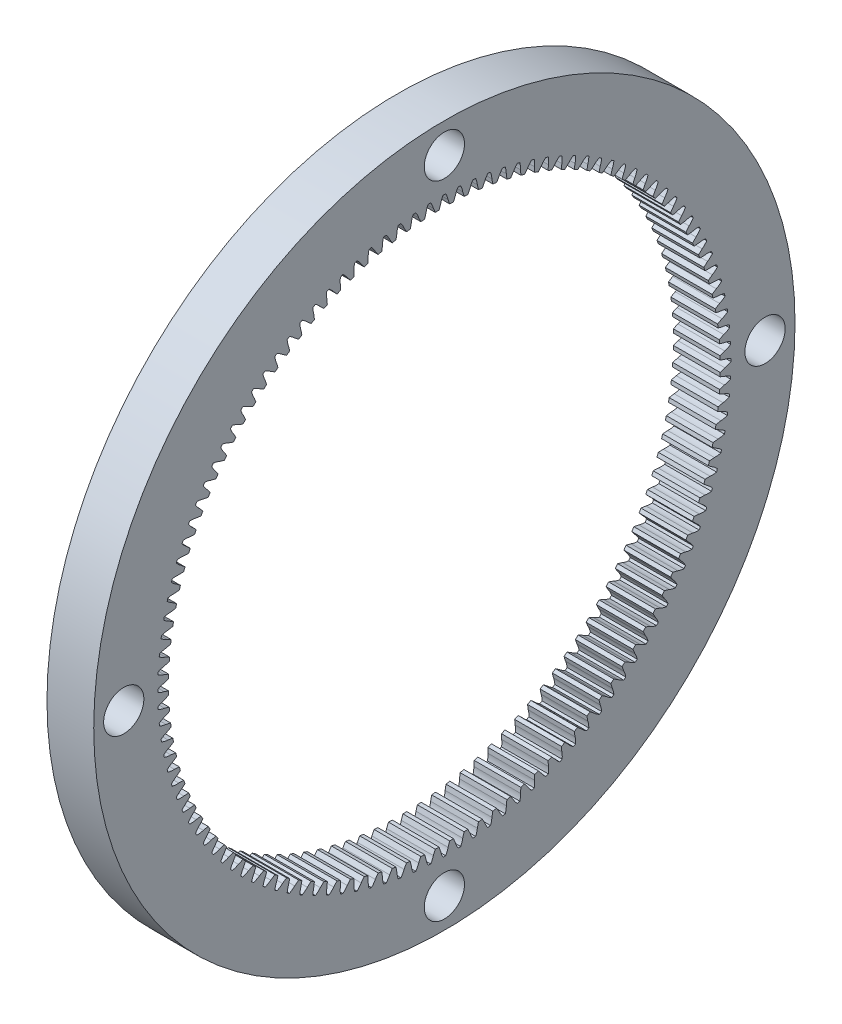
from build123d import *

# Parameters (mm, degrees)
SKETCH1_R           = 37.5
BOSS_EXTRUDE1_DEPTH = 5
SKETCH6_R           = 2.15265
CUT_EXTRUDE1_DEPTH  = 54.268189532


with BuildPart() as part:
    # Sketch1 → Boss-Extrude1 (new body)
    with BuildSketch(Plane(origin=(2.5, 0, 0), x_dir=(0, 0, -1), z_dir=(1, 0, 0))):
        Circle(SKETCH1_R)
        with BuildLine():
            Line((1.962088198, 29.935768069), (2.11114151, 29.424362041))
            ThreePointArc((2.11114151, 29.424362041), (2.314543324, 29.409061345), (2.51783448, 29.39235461))
            Line((2.51783448, 29.39235461), (2.745054228, 29.874147306))
            add(Edge.make_bspline(
                [(2.745054228, 29.874147306), (2.765284751, 29.944250325), (2.79139746, 30.012755765), (2.821044678, 30.079424721), (2.853637553, 30.152717703), (2.890844625, 30.224058561), (2.93133958, 30.293299556), (2.972275661, 30.363294818), (3.016714762, 30.431323694), (3.063881297, 30.497281388)],
                knots=[0, 0, 0, 0, 0.000218891, 0.000218891, 0.000218891, 0.00045944, 0.00045944, 0.00045944, 0.000702536, 0.000702536, 0.000702536, 0.000702536], degree=3))
            ThreePointArc((3.063881297, 30.497281388), (3.203881022, 30.482891711), (3.343813199, 30.467859359))
            add(Edge.make_bspline(
                [(3.343813199, 30.467859359), (3.371059895, 30.403100388), (3.396130923, 30.337368768), (3.418597543, 30.270800323), (3.441068643, 30.204218602), (3.460998907, 30.136703577), (3.477813742, 30.068473545), (3.500195391, 29.977654894), (3.517227941, 29.885167015), (3.526116272, 29.792054378)],
                knots=[0, 0, 0, 0, 0.000210772, 0.000210772, 0.000210772, 0.000421616, 0.000421616, 0.000421616, 0.000702663, 0.000702663, 0.000702663, 0.000702663], degree=3))
            Line((3.526116272, 29.792054378), (3.648200389, 29.273548366))
            ThreePointArc((3.648200389, 29.273548366), (3.85052267, 29.247623411), (4.05266086, 29.220300135))
            Line((4.05266086, 29.220300135), (4.304784292, 29.689540788))
            add(Edge.make_bspline(
                [(4.304784292, 29.689540788), (4.328655999, 29.758488949), (4.358318219, 29.825533871), (4.39141399, 29.890559845), (4.427798057, 29.962046602), (4.46868783, 30.031342422), (4.512751081, 30.098369182), (4.557294329, 30.166126089), (4.605232884, 30.231735971), (4.655786739, 30.295134766)],
                knots=[0, 0, 0, 0, 0.000218891, 0.000218891, 0.000218891, 0.00045944, 0.00045944, 0.00045944, 0.000702536, 0.000702536, 0.000702536, 0.000702536], degree=3))
            ThreePointArc((4.655786739, 30.295134766), (4.794841501, 30.27343779), (4.933795173, 30.251102556))
            add(Edge.make_bspline(
                [(4.933795173, 30.251102556), (4.957615306, 30.185006352), (4.979211847, 30.1180527), (4.998163754, 30.050399673), (5.017119441, 29.982733154), (5.033488928, 29.914267586), (5.046709835, 29.845251041), (5.064307729, 29.753385488), (5.076476496, 29.660132945), (5.080479506, 29.566682736)],
                knots=[0, 0, 0, 0, 0.000210772, 0.000210772, 0.000210772, 0.000421616, 0.000421616, 0.000421616, 0.000702663, 0.000702663, 0.000702663, 0.000702663], degree=3))
            Line((5.080479506, 29.566682736), (5.175259803, 29.042497929))
            ThreePointArc((5.175259803, 29.042497929), (5.375948002, 29.006019773), (5.576379178, 28.968154847))
            Line((5.576379178, 28.968154847), (5.852715243, 29.423557302))
            add(Edge.make_bspline(
                [(5.852715243, 29.423557302), (5.880162702, 29.491161623), (5.913293131, 29.556562262), (5.949746742, 29.619767021), (5.989822273, 29.689251612), (6.034282671, 29.75631246), (6.081793445, 29.82094127), (6.129821771, 29.886274105), (6.181128383, 29.949285161), (6.234930992, 30.009951286)],
                knots=[0, 0, 0, 0, 0.000218891, 0.000218891, 0.000218891, 0.00045944, 0.00045944, 0.00045944, 0.000702536, 0.000702536, 0.000702536, 0.000702536], degree=3))
            ThreePointArc((6.234930992, 30.009951286), (6.372659653, 29.981006481), (6.510253958, 29.951429583))
            add(Edge.make_bspline(
                [(6.510253958, 29.951429583), (6.530582239, 29.884177312), (6.548645099, 29.816185141), (6.564030347, 29.747632964), (6.579418664, 29.679067115), (6.592182506, 29.609838664), (6.601773247, 29.540224775), (6.614539153, 29.447564118), (6.621810781, 29.353802511), (6.620917499, 29.260270871)],
                knots=[0, 0, 0, 0, 0.000210772, 0.000210772, 0.000210772, 0.000421616, 0.000421616, 0.000421616, 0.000702663, 0.000702663, 0.000702663, 0.000702663], degree=3))
            Line((6.620917499, 29.260270871), (6.68813419, 28.731844025))
            ThreePointArc((6.68813419, 28.731844025), (6.886638234, 28.684912652), (7.084813029, 28.636609861))
            Line((7.084813029, 28.636609861), (7.384604307, 29.07692589))
            add(Edge.make_bspline(
                [(7.384604307, 29.07692589), (7.415552288, 29.143001073), (7.452060118, 29.20657817), (7.491771652, 29.267788474), (7.535428803, 29.335080449), (7.583337964, 29.399722514), (7.634166036, 29.46177623), (7.685547797, 29.524505921), (7.74008184, 29.584745442), (7.796985733, 29.642512615)],
                knots=[0, 0, 0, 0, 0.000218891, 0.000218891, 0.000218891, 0.00045944, 0.00045944, 0.00045944, 0.000702536, 0.000702536, 0.000702536, 0.000702536], degree=3))
            ThreePointArc((7.796985733, 29.642512615), (7.933010788, 29.606399316), (8.068868589, 29.569661823))
            add(Edge.make_bspline(
                [(8.068868589, 29.569661823), (8.085649299, 29.501437819), (8.100128969, 29.432593492), (8.111905389, 29.363330062), (8.123684157, 29.294052818), (8.13280737, 29.224251234), (8.138741657, 29.154230807), (8.146640584, 29.061029023), (8.148995143, 28.967015346), (8.143208018, 28.873658639)],
                knots=[0, 0, 0, 0, 0.000210772, 0.000210772, 0.000210772, 0.000421616, 0.000421616, 0.000421616, 0.000702663, 0.000702663, 0.000702663, 0.000702663], degree=3))
            Line((8.143208018, 28.873658639), (8.182676866, 28.342438133))
            ThreePointArc((8.182676866, 28.342438133), (8.378452669, 28.285182179), (8.5738279, 28.226573918))
            Line((8.5738279, 28.226573918), (8.896252685, 28.650596646))
            add(Edge.make_bspline(
                [(8.896252685, 28.650596646), (8.93061636, 28.714961583), (8.970401525, 28.776540877), (9.013262136, 28.835588954), (9.060381246, 28.900503868), (9.111607853, 28.962549972), (9.165613908, 29.02185851), (9.220208271, 29.081813118), (9.277820269, 29.139115992), (9.337669479, 29.193825877)],
                knots=[0, 0, 0, 0, 0.000218891, 0.000218891, 0.000218891, 0.00045944, 0.00045944, 0.00045944, 0.000702536, 0.000702536, 0.000702536, 0.000702536], degree=3))
            ThreePointArc((9.337669479, 29.193825877), (9.471618091, 29.15064307), (9.605367013, 29.106845676))
            add(Edge.make_bspline(
                [(9.605367013, 29.106845676), (9.618554156, 29.037836937), (9.629410949, 28.968329151), (9.637546262, 28.898544313), (9.645683197, 28.828745558), (9.651140774, 28.758562164), (9.653402343, 28.688327121), (9.656412639, 28.594839669), (9.653843676, 28.500831605), (9.64317857, 28.407905714)],
                knots=[0, 0, 0, 0, 0.000210772, 0.000210772, 0.000210772, 0.000421616, 0.000421616, 0.000421616, 0.000702663, 0.000702663, 0.000702663, 0.000702663], degree=3))
            Line((9.64317857, 28.407905714), (9.654791394, 27.875347588))
            ThreePointArc((9.654791394, 27.875347588), (9.847302347, 27.807923987), (10.039342504, 27.739170898))
            Line((10.039342504, 27.739170898), (10.383517052, 28.145738108))
            add(Edge.make_bspline(
                [(10.383517052, 28.145738108), (10.421202234, 28.208216379), (10.464155686, 28.267629086), (10.510047895, 28.324353088), (10.560499815, 28.386713016), (10.614903459, 28.445993094), (10.67193947, 28.502393894), (10.729596794, 28.559409087), (10.790128839, 28.613618251), (10.852759321, 28.665120892)],
                knots=[0, 0, 0, 0, 0.000218891, 0.000218891, 0.000218891, 0.00045944, 0.00045944, 0.00045944, 0.000702536, 0.000702536, 0.000702536, 0.000702536], degree=3))
            ThreePointArc((10.852759321, 28.665120892), (10.984264348, 28.614986936), (11.115537793, 28.564249688))
            add(Edge.make_bspline(
                [(11.115537793, 28.564249688), (11.125095225, 28.494645361), (11.132299383, 28.424664632), (11.13677129, 28.354549663), (11.141244089, 28.28442071), (11.143021072, 28.214047872), (11.141603723, 28.143790722), (11.139717139, 28.050273845), (11.132231695, 27.956529065), (11.116717839, 27.864288695)],
                knots=[0, 0, 0, 0, 0.000210772, 0.000210772, 0.000210772, 0.000421616, 0.000421616, 0.000421616, 0.000702663, 0.000702663, 0.000702663, 0.000702663], degree=3))
            Line((11.116717839, 27.864288695), (11.10044281, 27.331852653))
            ThreePointArc((11.10044281, 27.331852653), (11.289161255, 27.254446209), (11.477339968, 27.175736738))
            Line((11.477339968, 27.175736738), (11.842320921, 27.563734058))
            add(Edge.make_bspline(
                [(11.842320921, 27.563734058), (11.883224316, 27.624154415), (11.929228323, 27.681237689), (11.978026344, 27.73548214), (12.031672787, 27.795116156), (12.089104353, 27.851467726), (12.149013988, 27.904806196), (12.209576239, 27.958725702), (12.272862415, 28.009692571), (12.338102504, 28.057846803)],
                knots=[0, 0, 0, 0, 0.000218891, 0.000218891, 0.000218891, 0.00045944, 0.00045944, 0.00045944, 0.000702536, 0.000702536, 0.000702536, 0.000702536], degree=3))
            ThreePointArc((12.338102504, 28.057846803), (12.4668035, 28.000899113), (12.595241656, 27.943361077))
            add(Edge.make_bspline(
                [(12.595241656, 27.943361077), (12.601143182, 27.873351942), (12.604674958, 27.803090084), (12.605471203, 27.732837163), (12.606267606, 27.662570231), (12.604359123, 27.592200836), (12.599266742, 27.52211415), (12.592488449, 27.42882417), (12.58010704, 27.335599623), (12.559786957, 27.244297598)],
                knots=[0, 0, 0, 0, 0.000210772, 0.000210772, 0.000210772, 0.000421616, 0.000421616, 0.000421616, 0.000702663, 0.000702663, 0.000702663, 0.000702663], degree=3))
            Line((12.559786957, 27.244297598), (12.515668683, 26.713443009))
            ThreePointArc((12.515668683, 26.713443009), (12.700077356, 26.626265888), (12.883878842, 26.537815773))
            Line((12.883878842, 26.537815773), (13.268665811, 26.906179729))
            add(Edge.make_bspline(
                [(13.268665811, 26.906179729), (13.312675307, 26.964376563), (13.361603775, 27.018973943), (13.413173854, 27.070590163), (13.46986778, 27.127334815), (13.530169852, 27.180603421), (13.592788902, 27.230733365), (13.656090084, 27.281409392), (13.721956928, 27.32899427), (13.789627806, 27.373668107)],
                knots=[0, 0, 0, 0, 0.000218891, 0.000218891, 0.000218891, 0.00045944, 0.00045944, 0.00045944, 0.000702536, 0.000702536, 0.000702536, 0.000702536], degree=3))
            ThreePointArc((13.789627806, 27.373668107), (13.915172009, 27.310062772), (14.040422838, 27.245881655))
            add(Edge.make_bspline(
                [(14.040422838, 27.245881655), (14.04265228, 27.175659605), (14.042501995, 27.105309199), (14.039620395, 27.035110885), (14.03673822, 26.964898572), (14.031149503, 26.894725498), (14.022396047, 26.825001378), (14.010744623, 26.732193997), (13.993501186, 26.639745203), (13.968430573, 26.549631774)],
                knots=[0, 0, 0, 0, 0.000210772, 0.000210772, 0.000210772, 0.000421616, 0.000421616, 0.000421616, 0.000702663, 0.000702663, 0.000702663, 0.000702663], degree=3))
            Line((13.968430573, 26.549631774), (13.896589978, 26.021813676))
            ThreePointArc((13.896589978, 26.021813676), (14.076183428, 25.925104824), (14.255103898, 25.827156499))
            Line((14.255103898, 25.827156499), (14.658642211, 26.174877431))
            add(Edge.make_bspline(
                [(14.658642211, 26.174877431), (14.70563718, 26.23069123), (14.757355999, 26.282653068), (14.811556788, 26.331499581), (14.871142803, 26.385199334), (14.934150096, 26.435238971), (14.999306927, 26.482022986), (15.065173536, 26.529316635), (15.133440511, 26.573389096), (15.203356696, 26.614460088)],
                knots=[0, 0, 0, 0, 0.000218891, 0.000218891, 0.000218891, 0.00045944, 0.00045944, 0.00045944, 0.000702536, 0.000702536, 0.000702536, 0.000702536], degree=3))
            ThreePointArc((15.203356696, 26.614460088), (15.3254, 26.544371446), (15.447120196, 26.473723166))
            add(Edge.make_bspline(
                [(15.447120196, 26.473723166), (15.445671445, 26.403480672), (15.44183951, 26.333234544), (15.435287963, 26.263283246), (15.428735109, 26.193317998), (15.419481477, 26.123533584), (15.407090939, 26.054363139), (15.390598319, 25.962292736), (15.368540119, 25.870873092), (15.338787691, 25.782195255)],
                knots=[0, 0, 0, 0, 0.000210772, 0.000210772, 0.000210772, 0.000421616, 0.000421616, 0.000421616, 0.000702663, 0.000702663, 0.000702663, 0.000702663], degree=3))
            Line((15.338787691, 25.782195255), (15.239421687, 25.258860359))
            ThreePointArc((15.239421687, 25.258860359), (15.413707659, 25.152884848), (15.587256706, 25.045706785))
            Line((15.587256706, 25.045706785), (16.008440291, 25.371831614))
            add(Edge.make_bspline(
                [(16.008440291, 25.371831614), (16.058291924, 25.425109395), (16.112659336, 25.474293267), (16.169342274, 25.520236187), (16.231657056, 25.570743856), (16.297196872, 25.617417369), (16.364712894, 25.660727222), (16.432964393, 25.704508866), (16.503444386, 25.744948109), (16.575414243, 25.782303685)],
                knots=[0, 0, 0, 0, 0.000218891, 0.000218891, 0.000218891, 0.00045944, 0.00045944, 0.00045944, 0.000702536, 0.000702536, 0.000702536, 0.000702536], degree=3))
            ThreePointArc((16.575414243, 25.782303685), (16.693622134, 25.705923844), (16.811478072, 25.629002042))
            add(Edge.make_bspline(
                [(16.811478072, 25.629002042), (16.806355099, 25.558931634), (16.798852017, 25.488982324), (16.78864848, 25.419469773), (16.778442909, 25.349943359), (16.765549724, 25.280738881), (16.749556065, 25.212311702), (16.728267455, 25.121230635), (16.70145495, 25.031090716), (16.667102258, 24.944091531)],
                knots=[0, 0, 0, 0, 0.000210772, 0.000210772, 0.000210772, 0.000421616, 0.000421616, 0.000421616, 0.000702663, 0.000702663, 0.000702663, 0.000702663], degree=3))
            Line((16.667102258, 24.944091531), (16.540483199, 24.426674263))
            ThreePointArc((16.540483199, 24.426674263), (16.708983989, 24.311722564), (16.876685927, 24.19560853))
            Line((16.876685927, 24.19560853), (17.314360349, 24.49924337))
            add(Edge.make_bspline(
                [(17.314360349, 24.49924337), (17.366932006, 24.549839103), (17.423798995, 24.5961102), (17.482808717, 24.639023601), (17.547681466, 24.686200748), (17.615574165, 24.729380207), (17.685264322, 24.76909719), (17.755713638, 24.809246825), (17.828213467, 24.845942009), (17.902039731, 24.879479779)],
                knots=[0, 0, 0, 0, 0.000218891, 0.000218891, 0.000218891, 0.00045944, 0.00045944, 0.00045944, 0.000702536, 0.000702536, 0.000702536, 0.000702536], degree=3))
            ThreePointArc((17.902039731, 24.879479779), (18.016088211, 24.797018091), (18.129756855, 24.714033605))
            add(Edge.make_bspline(
                [(18.129756855, 24.714033605), (18.120973701, 24.644327342), (18.109820037, 24.574866576), (18.095992479, 24.505983301), (18.082162162, 24.437086289), (18.065664765, 24.36865143), (18.046111823, 24.301155072), (18.020085574, 24.211312988), (17.988592255, 24.122699861), (17.949733457, 24.037617786)],
                knots=[0, 0, 0, 0, 0.000210772, 0.000210772, 0.000210772, 0.000421616, 0.000421616, 0.000421616, 0.000702663, 0.000702663, 0.000702663, 0.000702663], degree=3))
            Line((17.949733457, 24.037617786), (17.796208397, 23.527536349))
            ThreePointArc((17.796208397, 23.527536349), (17.958462156, 23.403923539), (18.119857325, 23.279191793))
            Line((18.119857325, 23.279191793), (18.572822949, 23.559504403))
            add(Edge.make_bspline(
                [(18.572822949, 23.559504403), (18.627970534, 23.607279408), (18.687181231, 23.650510904), (18.748355996, 23.690277163), (18.8156089, 23.733994478), (18.885668393, 23.773561532), (18.957341668, 23.809576783), (19.029795706, 23.845984362), (19.104116653, 23.878834909), (19.179596973, 23.908462949)],
                knots=[0, 0, 0, 0, 0.000218891, 0.000218891, 0.000218891, 0.00045944, 0.00045944, 0.00045944, 0.000702536, 0.000702536, 0.000702536, 0.000702536], degree=3))
            ThreePointArc((19.179596973, 23.908462949), (19.289173442, 23.820145435), (19.398343235, 23.731325719))
            add(Edge.make_bspline(
                [(19.398343235, 23.731325719), (19.385923973, 23.662174661), (19.3711503, 23.593392826), (19.35373662, 23.525327632), (19.336319466, 23.457248864), (19.316263074, 23.3897712), (19.293204442, 23.323390665), (19.26251189, 23.235033815), (19.226424079, 23.148190362), (19.183165684, 23.065258602)],
                knots=[0, 0, 0, 0, 0.000210772, 0.000210772, 0.000210772, 0.000421616, 0.000421616, 0.000421616, 0.000702663, 0.000702663, 0.000702663, 0.000702663], degree=3))
            Line((19.183165684, 23.065258602), (19.003155425, 22.563911095))
            ThreePointArc((19.003155425, 22.563911095), (19.158717426, 22.431975985), (19.313363453, 22.298968409))
            Line((19.313363453, 22.298968409), (19.780378732, 22.555190472))
            add(Edge.make_bspline(
                [(19.780378732, 22.555190472), (19.83795109, 22.600013801), (19.899343202, 22.640087201), (19.962515334, 22.676597323), (20.031964058, 22.716734979), (20.103998316, 22.752581177), (20.177458259, 22.784795982), (20.251718426, 22.817361714), (20.327656785, 22.846277583), (20.404584273, 22.871914684)],
                knots=[0, 0, 0, 0, 0.000218891, 0.000218891, 0.000218891, 0.00045944, 0.00045944, 0.00045944, 0.000702536, 0.000702536, 0.000702536, 0.000702536], degree=3))
            ThreePointArc((20.404584273, 22.871914684), (20.509388389, 22.777983417), (20.613760104, 22.683571919))
            add(Edge.make_bspline(
                [(20.613760104, 22.683571919), (20.597738776, 22.615165604), (20.579385587, 22.547251227), (20.558433514, 22.480190676), (20.537477263, 22.413116751), (20.513916849, 22.346781233), (20.48741573, 22.281698466), (20.452141, 22.19506903), (20.411557611, 22.110233282), (20.364018187, 22.029679146)],
                knots=[0, 0, 0, 0, 0.000210772, 0.000210772, 0.000210772, 0.000421616, 0.000421616, 0.000421616, 0.000702663, 0.000702663, 0.000702663, 0.000702663], degree=3))
            Line((20.364018187, 22.029679146), (20.158016125, 21.538439728))
            ThreePointArc((20.158016125, 21.538439728), (20.306459983, 21.398543945), (20.453932995, 21.257625104))
            Line((20.453932995, 21.257625104), (20.933717872, 21.489054331))
            add(Edge.make_bspline(
                [(20.933717872, 21.489054331), (20.993557201, 21.530803128), (21.056962457, 21.567608594), (21.121958806, 21.600762505), (21.193412996, 21.637210489), (21.267224579, 21.669237579), (21.342269839, 21.697563638), (21.418132594, 21.726198263), (21.495480221, 21.751100197), (21.573644025, 21.77267609)],
                knots=[0, 0, 0, 0, 0.000218891, 0.000218891, 0.000218891, 0.00045944, 0.00045944, 0.00045944, 0.000702536, 0.000702536, 0.000702536, 0.000702536], degree=3))
            ThreePointArc((21.573644025, 21.77267609), (21.673388529, 21.673388529), (21.77267609, 21.573644025))
            add(Edge.make_bspline(
                [(21.77267609, 21.573644025), (21.753096609, 21.506169951), (21.731214208, 21.439309179), (21.706781171, 21.373437079), (21.682343261, 21.307551842), (21.655343404, 21.242540292), (21.625472435, 21.17893368), (21.585712213, 21.094269103), (21.540744483, 21.01167359), (21.489054331, 20.933717872)],
                knots=[0, 0, 0, 0, 0.000210772, 0.000210772, 0.000210772, 0.000421616, 0.000421616, 0.000421616, 0.000702663, 0.000702663, 0.000702663, 0.000702663], degree=3))
            Line((21.489054331, 20.933717872), (21.257625104, 20.453932995))
            ThreePointArc((21.257625104, 20.453932995), (21.398543945, 20.306459983), (21.538439728, 20.158016125))
            Line((21.538439728, 20.158016125), (22.029679146, 20.364018187))
            add(Edge.make_bspline(
                [(22.029679146, 20.364018187), (22.091621431, 20.402578019), (22.156866041, 20.43601467), (22.223508457, 20.465721499), (22.296772261, 20.498379909), (22.372158856, 20.526500107), (22.448583741, 20.550859781), (22.525841149, 20.575484813), (22.604386041, 20.596304558), (22.683571919, 20.613760104)],
                knots=[0, 0, 0, 0, 0.000218891, 0.000218891, 0.000218891, 0.00045944, 0.00045944, 0.00045944, 0.000702536, 0.000702536, 0.000702536, 0.000702536], degree=3))
            ThreePointArc((22.683571919, 20.613760104), (22.777983417, 20.509388389), (22.871914684, 20.404584273))
            add(Edge.make_bspline(
                [(22.871914684, 20.404584273), (22.848830715, 20.33822738), (22.823479081, 20.272603475), (22.795632049, 20.208100377), (22.767779464, 20.143584414), (22.737414167, 20.080075023), (22.704255222, 20.018118907), (22.660118489, 19.93565125), (22.61088967, 19.855522361), (22.555190472, 19.780378732)],
                knots=[0, 0, 0, 0, 0.000210772, 0.000210772, 0.000210772, 0.000421616, 0.000421616, 0.000421616, 0.000702663, 0.000702663, 0.000702663, 0.000702663], degree=3))
            Line((22.555190472, 19.780378732), (22.298968409, 19.313363453))
            ThreePointArc((22.298968409, 19.313363453), (22.431975985, 19.158717426), (22.563911095, 19.003155425))
            Line((22.563911095, 19.003155425), (23.065258602, 19.183165684))
            add(Edge.make_bspline(
                [(23.065258602, 19.183165684), (23.129134062, 19.218430863), (23.196039197, 19.248407051), (23.264145017, 19.274585373), (23.339017624, 19.303364694), (23.415772602, 19.327500926), (23.493367636, 19.347827446), (23.57180794, 19.36837539), (23.65133481, 19.38505588), (23.731325719, 19.398343235)],
                knots=[0, 0, 0, 0, 0.000218891, 0.000218891, 0.000218891, 0.00045944, 0.00045944, 0.00045944, 0.000702536, 0.000702536, 0.000702536, 0.000702536], degree=3))
            ThreePointArc((23.731325719, 19.398343235), (23.820145435, 19.289173442), (23.908462949, 19.179596973))
            add(Edge.make_bspline(
                [(23.908462949, 19.179596973), (23.881937765, 19.114539142), (23.853186384, 19.050331974), (23.822001685, 18.987374676), (23.790810766, 18.924404822), (23.757163259, 18.862571665), (23.720807224, 18.802435863), (23.672414956, 18.722391163), (23.619059981, 18.644948525), (23.559504403, 18.572822949)],
                knots=[0, 0, 0, 0, 0.000210772, 0.000210772, 0.000210772, 0.000421616, 0.000421616, 0.000421616, 0.000702663, 0.000702663, 0.000702663, 0.000702663], degree=3))
            Line((23.559504403, 18.572822949), (23.279191793, 18.119857325))
            ThreePointArc((23.279191793, 18.119857325), (23.403923539, 17.958462156), (23.527536349, 17.796208397))
            Line((23.527536349, 17.796208397), (24.037617786, 17.949733457))
            add(Edge.make_bspline(
                [(24.037617786, 17.949733457), (24.103251344, 17.981607323), (24.17163362, 18.008040885), (24.24101617, 18.030618948), (24.317292361, 18.055440298), (24.395205341, 18.075526407), (24.473757842, 18.09176406), (24.553166043, 18.108178595), (24.633456913, 18.120674111), (24.714033605, 18.129756855)],
                knots=[0, 0, 0, 0, 0.000218891, 0.000218891, 0.000218891, 0.00045944, 0.00045944, 0.00045944, 0.000702536, 0.000702536, 0.000702536, 0.000702536], degree=3))
            ThreePointArc((24.714033605, 18.129756855), (24.797018091, 18.016088211), (24.879479779, 17.902039731))
            add(Edge.make_bspline(
                [(24.879479779, 17.902039731), (24.849586083, 17.83845928), (24.817513762, 17.775844837), (24.78307687, 17.714605901), (24.748633109, 17.653354751), (24.711795618, 17.593367309), (24.672342143, 17.535216649), (24.619826978, 17.457814303), (24.56249209, 17.383270181), (24.49924337, 17.314360349)],
                knots=[0, 0, 0, 0, 0.000210772, 0.000210772, 0.000210772, 0.000421616, 0.000421616, 0.000421616, 0.000702663, 0.000702663, 0.000702663, 0.000702663], degree=3))
            Line((24.49924337, 17.314360349), (24.19560853, 16.876685927))
            ThreePointArc((24.19560853, 16.876685927), (24.311722564, 16.708983989), (24.426674263, 16.540483199))
            Line((24.426674263, 16.540483199), (24.944091531, 16.667102258))
            add(Edge.make_bspline(
                [(24.944091531, 16.667102258), (25.01130329, 16.695497447), (25.080975276, 16.718315932), (25.151444385, 16.73723185), (25.228915091, 16.758027196), (25.30777252, 16.774008127), (25.38706718, 16.786112406), (25.467225625, 16.798348542), (25.548060424, 16.806624834), (25.629002042, 16.811478072)],
                knots=[0, 0, 0, 0, 0.000218891, 0.000218891, 0.000218891, 0.00045944, 0.00045944, 0.00045944, 0.000702536, 0.000702536, 0.000702536, 0.000702536], degree=3))
            ThreePointArc((25.629002042, 16.811478072), (25.705923844, 16.693622134), (25.782303685, 16.575414243))
            add(Edge.make_bspline(
                [(25.782303685, 16.575414243), (25.749123414, 16.513485442), (25.71381806, 16.452635346), (25.676223364, 16.393282623), (25.63862117, 16.333918064), (25.598694663, 16.275940758), (25.556251888, 16.219934626), (25.499757767, 16.145386789), (25.438600117, 16.073945503), (25.371831614, 16.008440291)],
                knots=[0, 0, 0, 0, 0.000210772, 0.000210772, 0.000210772, 0.000421616, 0.000421616, 0.000421616, 0.000702663, 0.000702663, 0.000702663, 0.000702663], degree=3))
            Line((25.371831614, 16.008440291), (25.045706785, 15.587256706))
            ThreePointArc((25.045706785, 15.587256706), (25.152884848, 15.413707659), (25.258860359, 15.239421687))
            Line((25.258860359, 15.239421687), (25.782195255, 15.338787691))
            add(Edge.make_bspline(
                [(25.782195255, 15.338787691), (25.850800992, 15.363626374), (25.921571722, 15.382767236), (25.992934238, 15.397969162), (26.071387118, 15.414681506), (26.150972853, 15.426513456), (26.230792331, 15.434451186), (26.311481312, 15.442475383), (26.392638477, 15.446509766), (26.473723166, 15.447120196)],
                knots=[0, 0, 0, 0, 0.000218891, 0.000218891, 0.000218891, 0.00045944, 0.00045944, 0.00045944, 0.000702536, 0.000702536, 0.000702536, 0.000702536], degree=3))
            ThreePointArc((26.473723166, 15.447120196), (26.544371446, 15.3254), (26.614460088, 15.203356696))
            add(Edge.make_bspline(
                [(26.614460088, 15.203356696), (26.578084186, 15.143249288), (26.539642569, 15.084330324), (26.498993114, 15.027026496), (26.458335552, 14.969711241), (26.415429465, 14.913902982), (26.370113721, 14.860194889), (26.309795492, 14.78870589), (26.244982708, 14.720563256), (26.174877431, 14.658642211)],
                knots=[0, 0, 0, 0, 0.000210772, 0.000210772, 0.000210772, 0.000421616, 0.000421616, 0.000421616, 0.000702663, 0.000702663, 0.000702663, 0.000702663], degree=3))
            Line((26.174877431, 14.658642211), (25.827156499, 14.255103898))
            ThreePointArc((25.827156499, 14.255103898), (25.925104824, 14.076183428), (26.021813676, 13.896589978))
            Line((26.021813676, 13.896589978), (26.549631774, 13.968430573))
            add(Edge.make_bspline(
                [(26.549631774, 13.968430573), (26.619443445, 13.989644668), (26.691118942, 14.005055445), (26.763179266, 14.016501712), (26.842399284, 14.029085245), (26.922495186, 14.036735785), (27.002620704, 14.040485207), (27.083619057, 14.044275473), (27.164876143, 14.044056889), (27.245881655, 14.040422838)],
                knots=[0, 0, 0, 0, 0.000218891, 0.000218891, 0.000218891, 0.00045944, 0.00045944, 0.00045944, 0.000702536, 0.000702536, 0.000702536, 0.000702536], degree=3))
            ThreePointArc((27.245881655, 14.040422838), (27.310062772, 13.915172009), (27.373668107, 13.789627806))
            add(Edge.make_bspline(
                [(27.373668107, 13.789627806), (27.334196278, 13.73150654), (27.292723763, 13.674680201), (27.249130966, 13.619582335), (27.205529475, 13.56447348), (27.159761411, 13.510987236), (27.111696907, 13.459724391), (27.047719896, 13.391490178), (26.979429626, 13.32683297), (26.906179729, 13.268665811)],
                knots=[0, 0, 0, 0, 0.000210772, 0.000210772, 0.000210772, 0.000421616, 0.000421616, 0.000421616, 0.000702663, 0.000702663, 0.000702663, 0.000702663], degree=3))
            Line((26.906179729, 13.268665811), (26.537815773, 12.883878842))
            ThreePointArc((26.537815773, 12.883878842), (26.626265888, 12.700077356), (26.713443009, 12.515668683))
            Line((26.713443009, 12.515668683), (27.244297598, 12.559786957))
            add(Edge.make_bspline(
                [(27.244297598, 12.559786957), (27.315123854, 12.577318319), (27.38750766, 12.58895677), (27.460068278, 12.596616004), (27.5398383, 12.605036237), (27.620224832, 12.608484396), (27.70043677, 12.608035235), (27.781522485, 12.60758118), (27.862656771, 12.603110228), (27.943361077, 12.595241656)],
                knots=[0, 0, 0, 0, 0.000218891, 0.000218891, 0.000218891, 0.00045944, 0.00045944, 0.00045944, 0.000702536, 0.000702536, 0.000702536, 0.000702536], degree=3))
            ThreePointArc((27.943361077, 12.595241656), (28.000899113, 12.4668035), (28.057846803, 12.338102504))
            add(Edge.make_bspline(
                [(28.057846803, 12.338102504), (28.015387237, 12.282126687), (27.970997499, 12.227548731), (27.924580845, 12.174807845), (27.878154933, 12.122056441), (27.829650339, 12.071038814), (27.778968816, 12.022361724), (27.711508381, 11.957569321), (27.639927802, 11.89657476), (27.563734058, 11.842320921)],
                knots=[0, 0, 0, 0, 0.000210772, 0.000210772, 0.000210772, 0.000421616, 0.000421616, 0.000421616, 0.000702663, 0.000702663, 0.000702663, 0.000702663], degree=3))
            Line((27.563734058, 11.842320921), (27.175736738, 11.477339968))
            ThreePointArc((27.175736738, 11.477339968), (27.254446209, 11.289161255), (27.331852653, 11.10044281))
            Line((27.331852653, 11.10044281), (27.864288695, 11.116717839))
            add(Edge.make_bspline(
                [(27.864288695, 11.116717839), (27.935935408, 11.130518415), (28.008829124, 11.13835264), (28.081691155, 11.142203848), (28.161792535, 11.146437701), (28.242249362, 11.145674029), (28.322327865, 11.141027514), (28.403278691, 11.136330383), (28.484067794, 11.127619318), (28.564249688, 11.115537793)],
                knots=[0, 0, 0, 0, 0.000218891, 0.000218891, 0.000218891, 0.00045944, 0.00045944, 0.00045944, 0.000702536, 0.000702536, 0.000702536, 0.000702536], degree=3))
            ThreePointArc((28.564249688, 11.115537793), (28.614986936, 10.984264348), (28.665120892, 10.852759321))
            add(Edge.make_bspline(
                [(28.665120892, 10.852759321), (28.619789967, 10.799082379), (28.572604674, 10.746902399), (28.523491387, 10.696663052), (28.474368305, 10.646413686), (28.423260128, 10.598004511), (28.3701005, 10.552046597), (28.299341545, 10.490873597), (28.224666857, 10.433708865), (28.145738108, 10.383517052)],
                knots=[0, 0, 0, 0, 0.000210772, 0.000210772, 0.000210772, 0.000421616, 0.000421616, 0.000421616, 0.000702663, 0.000702663, 0.000702663, 0.000702663], degree=3))
            Line((28.145738108, 10.383517052), (27.739170898, 10.039342504))
            ThreePointArc((27.739170898, 10.039342504), (27.807923987, 9.847302347), (27.875347588, 9.654791394))
            Line((27.875347588, 9.654791394), (28.407905714, 9.64317857))
            add(Edge.make_bspline(
                [(28.407905714, 9.64317857), (28.480176504, 9.653210533), (28.553380333, 9.657219059), (28.626344065, 9.657251686), (28.706557252, 9.657287554), (28.786863849, 9.652314143), (28.866589427, 9.643483011), (28.947183484, 9.634555678), (29.027405966, 9.621628376), (29.106845676, 9.605367013)],
                knots=[0, 0, 0, 0, 0.000218891, 0.000218891, 0.000218891, 0.00045944, 0.00045944, 0.00045944, 0.000702536, 0.000702536, 0.000702536, 0.000702536], degree=3))
            ThreePointArc((29.106845676, 9.605367013), (29.15064307, 9.471618091), (29.193825877, 9.337669479))
            add(Edge.make_bspline(
                [(29.193825877, 9.337669479), (29.145747843, 9.286438536), (29.095896326, 9.236799555), (29.044221023, 9.18919945), (28.992535414, 9.141589852), (28.938963738, 9.095921816), (28.883471712, 9.052809045), (28.809608182, 8.995423118), (28.732044063, 8.9422449), (28.650596646, 8.896252685)],
                knots=[0, 0, 0, 0, 0.000210772, 0.000210772, 0.000210772, 0.000421616, 0.000421616, 0.000421616, 0.000702663, 0.000702663, 0.000702663, 0.000702663], degree=3))
            Line((28.650596646, 8.896252685), (28.226573918, 8.5738279))
            ThreePointArc((28.226573918, 8.5738279), (28.285182179, 8.378452669), (28.342438133, 8.182676866))
            Line((28.342438133, 8.182676866), (28.873658639, 8.143208018))
            add(Edge.make_bspline(
                [(28.873658639, 8.143208018), (28.946355416, 8.149443872), (29.019668712, 8.149615712), (29.092534157, 8.145829667), (29.172639292, 8.141667452), (29.252575543, 8.132497935), (29.331729674, 8.119506391), (29.41174606, 8.106373326), (29.491182037, 8.089265221), (29.569661823, 8.068868589)],
                knots=[0, 0, 0, 0, 0.000218891, 0.000218891, 0.000218891, 0.00045944, 0.00045944, 0.00045944, 0.000702536, 0.000702536, 0.000702536, 0.000702536], degree=3))
            ThreePointArc((29.569661823, 8.068868589), (29.606399316, 7.933010788), (29.642512615, 7.796985733))
            add(Edge.make_bspline(
                [(29.642512615, 7.796985733), (29.591819249, 7.748341211), (29.539438149, 7.701379285), (29.485342468, 7.656548892), (29.431235999, 7.611709557), (29.375347662, 7.568907832), (29.317675337, 7.528758375), (29.240909687, 7.475316811), (29.160668733, 7.426270864), (29.07692589, 7.384604307)],
                knots=[0, 0, 0, 0, 0.000210772, 0.000210772, 0.000210772, 0.000421616, 0.000421616, 0.000421616, 0.000702663, 0.000702663, 0.000702663, 0.000702663], degree=3))
            Line((29.07692589, 7.384604307), (28.636609861, 7.084813029))
            ThreePointArc((28.636609861, 7.084813029), (28.684912652, 6.886638234), (28.731844025, 6.68813419))
            Line((28.731844025, 6.68813419), (29.260270871, 6.620917499))
            add(Edge.make_bspline(
                [(29.260270871, 6.620917499), (29.33319438, 6.623340152), (29.406416196, 6.619674835), (29.478983636, 6.612080496), (29.558761156, 6.603731607), (29.638107961, 6.590391116), (29.71647369, 6.573274769), (29.795693084, 6.555971969), (29.874124828, 6.534729951), (29.951429583, 6.510253958)],
                knots=[0, 0, 0, 0, 0.000218891, 0.000218891, 0.000218891, 0.00045944, 0.00045944, 0.00045944, 0.000702536, 0.000702536, 0.000702536, 0.000702536], degree=3))
            ThreePointArc((29.951429583, 6.510253958), (29.981006481, 6.372659653), (30.009951286, 6.234930992))
            add(Edge.make_bspline(
                [(30.009951286, 6.234930992), (29.956781536, 6.189006221), (29.902014424, 6.14485007), (29.845646638, 6.102912264), (29.78926761, 6.060966094), (29.731215796, 6.021147996), (29.671521249, 5.984071898), (29.592063889, 5.934721179), (29.509366037, 5.889941935), (29.423557302, 5.852715243)],
                knots=[0, 0, 0, 0, 0.000210772, 0.000210772, 0.000210772, 0.000421616, 0.000421616, 0.000421616, 0.000702663, 0.000702663, 0.000702663, 0.000702663], degree=3))
            Line((29.423557302, 5.852715243), (28.968154847, 5.576379178))
            ThreePointArc((28.968154847, 5.576379178), (29.006019773, 5.375948002), (29.042497929, 5.175259803))
            Line((29.042497929, 5.175259803), (29.566682736, 5.080479506))
            add(Edge.make_bspline(
                [(29.566682736, 5.080479506), (29.639633097, 5.079082317), (29.712562737, 5.07158989), (29.784633268, 5.060208072), (29.863864509, 5.047695392), (29.942404385, 5.030220492), (30.019766916, 5.009026258), (30.097972184, 4.987601147), (30.175184719, 4.962283441), (30.251102556, 4.933795173)],
                knots=[0, 0, 0, 0, 0.000218891, 0.000218891, 0.000218891, 0.00045944, 0.00045944, 0.00045944, 0.000702536, 0.000702536, 0.000702536, 0.000702536], degree=3))
            ThreePointArc((30.251102556, 4.933795173), (30.27343779, 4.794841501), (30.295134766, 4.655786739))
            add(Edge.make_bspline(
                [(30.295134766, 4.655786739), (30.239634367, 4.612707596), (30.182631357, 4.571478248), (30.124145966, 4.532547978), (30.065648912, 4.493609945), (30.005592737, 4.456884613), (29.944039587, 4.422983499), (29.862108303, 4.377858889), (29.77718022, 4.337469084), (29.689540788, 4.304784292)],
                knots=[0, 0, 0, 0, 0.000210772, 0.000210772, 0.000210772, 0.000421616, 0.000421616, 0.000421616, 0.000702663, 0.000702663, 0.000702663, 0.000702663], degree=3))
            Line((29.689540788, 4.304784292), (29.220300135, 4.05266086))
            ThreePointArc((29.220300135, 4.05266086), (29.247623411, 3.85052267), (29.273548366, 3.648200389))
            Line((29.273548366, 3.648200389), (29.792054378, 3.526116272))
            add(Edge.make_bspline(
                [(29.792054378, 3.526116272), (29.864831639, 3.520903071), (29.937269208, 3.509604069), (30.008645291, 3.49446597), (30.087113085, 3.477823794), (30.16463076, 3.456262384), (30.240778047, 3.431048354), (30.317754834, 3.405559658), (30.393536526, 3.376235657), (30.467859359, 3.343813199)],
                knots=[0, 0, 0, 0, 0.000218891, 0.000218891, 0.000218891, 0.00045944, 0.00045944, 0.00045944, 0.000702536, 0.000702536, 0.000702536, 0.000702536], degree=3))
            ThreePointArc((30.467859359, 3.343813199), (30.482891711, 3.203881022), (30.497281388, 3.063881297))
            add(Edge.make_bspline(
                [(30.497281388, 3.063881297), (30.439602462, 3.023765859), (30.380519795, 2.985576322), (30.320077104, 2.949760294), (30.259622358, 2.913937122), (30.197726433, 2.880405219), (30.134483391, 2.849772007), (30.050302752, 2.808997192), (29.963377221, 2.773107533), (29.874147306, 2.745054228)],
                knots=[0, 0, 0, 0, 0.000210772, 0.000210772, 0.000210772, 0.000421616, 0.000421616, 0.000421616, 0.000702663, 0.000702663, 0.000702663, 0.000702663], degree=3))
            Line((29.874147306, 2.745054228), (29.39235461, 2.51783448))
            ThreePointArc((29.39235461, 2.51783448), (29.409061345, 2.314543324), (29.424362041, 2.11114151))
            Line((29.424362041, 2.11114151), (29.935768069, 1.962088198))
            add(Edge.make_bspline(
                [(29.935768069, 1.962088198), (30.008172755, 1.953073273), (30.079919707, 1.937998667), (30.150405705, 1.919145778), (30.227894977, 1.898419724), (30.304177979, 1.872830901), (30.378901309, 1.843666185), (30.454438627, 1.814183767), (30.528581762, 1.780933846), (30.601105878, 1.744666065)],
                knots=[0, 0, 0, 0, 0.000218891, 0.000218891, 0.000218891, 0.00045944, 0.00045944, 0.00045944, 0.000702536, 0.000702536, 0.000702536, 0.000702536], degree=3))
            ThreePointArc((30.601105878, 1.744666065), (30.608794144, 1.604138928), (30.615837081, 1.46357797))
            add(Edge.make_bspline(
                [(30.615837081, 1.46357797), (30.556137722, 1.426536191), (30.495137341, 1.391491139), (30.432903017, 1.358887521), (30.370656282, 1.326277401), (30.30709026, 1.296030835), (30.242330672, 1.26874949), (30.156131411, 1.232436229), (30.067446689, 1.201145086), (29.976870864, 1.17780016)],
                knots=[0, 0, 0, 0, 0.000210772, 0.000210772, 0.000210772, 0.000421616, 0.000421616, 0.000421616, 0.000702663, 0.000702663, 0.000702663, 0.000702663], degree=3))
            Line((29.976870864, 1.17780016), (29.483846685, 0.97610689))
            ThreePointArc((29.483846685, 0.97610689), (29.489891087, 0.772219975), (29.494525585, 0.56829614))
            Line((29.494525585, 0.56829614), (29.997429902, 0.392682176))
            add(Edge.make_bspline(
                [(29.997429902, 0.392682176), (30.069263554, 0.379890238), (30.140123235, 0.361081346), (30.20952595, 0.338565342), (30.285824309, 0.313812217), (30.360663552, 0.284266119), (30.433758113, 0.251230655), (30.507648919, 0.217835323), (30.579950277, 0.180750619), (30.650476893, 0.140736922)],
                knots=[0, 0, 0, 0, 0.000218891, 0.000218891, 0.000218891, 0.00045944, 0.00045944, 0.00045944, 0.000702536, 0.000702536, 0.000702536, 0.000702536], degree=3))
            ThreePointArc((30.650476893, 0.140736922), (30.6508, 0), (30.650476893, -0.140736922))
            add(Edge.make_bspline(
                [(30.650476893, -0.140736922), (30.588920733, -0.174603514), (30.526169835, -0.206408025), (30.46231446, -0.235709867), (30.398446351, -0.265017554), (30.33338446, -0.29189588), (30.267285829, -0.315750581), (30.17930421, -0.347502756), (30.089103375, -0.374109616), (29.997429902, -0.392682176)],
                knots=[0, 0, 0, 0, 0.000210772, 0.000210772, 0.000210772, 0.000421616, 0.000421616, 0.000421616, 0.000702663, 0.000702663, 0.000702663, 0.000702663], degree=3))
            Line((29.997429902, -0.392682176), (29.494525585, -0.56829614))
            ThreePointArc((29.494525585, -0.56829614), (29.489891087, -0.772219975), (29.483846685, -0.97610689))
            Line((29.483846685, -0.97610689), (29.976870864, -1.17780016))
            add(Edge.make_bspline(
                [(29.976870864, -1.17780016), (30.047936592, -1.19433405), (30.117714782, -1.216825674), (30.185843986, -1.242943078), (30.260742302, -1.271655428), (30.333932657, -1.305077817), (30.405198102, -1.341893481), (30.477239867, -1.379110191), (30.547501275, -1.419928034), (30.615837081, -1.46357797)],
                knots=[0, 0, 0, 0, 0.000218891, 0.000218891, 0.000218891, 0.00045944, 0.00045944, 0.00045944, 0.000702536, 0.000702536, 0.000702536, 0.000702536], degree=3))
            ThreePointArc((30.615837081, -1.46357797), (30.608794144, -1.604138928), (30.601105878, -1.744666065))
            add(Edge.make_bspline(
                [(30.601105878, -1.744666065), (30.537861639, -1.775264643), (30.473532218, -1.803741439), (30.408230815, -1.829661192), (30.342916389, -1.855586115), (30.27653696, -1.879022529), (30.209280456, -1.899385203), (30.119757633, -1.92648926), (30.02828792, -1.948338909), (29.935768069, -1.962088198)],
                knots=[0, 0, 0, 0, 0.000210772, 0.000210772, 0.000210772, 0.000421616, 0.000421616, 0.000421616, 0.000702663, 0.000702663, 0.000702663, 0.000702663], degree=3))
            Line((29.935768069, -1.962088198), (29.424362041, -2.11114151))
            ThreePointArc((29.424362041, -2.11114151), (29.409061345, -2.314543324), (29.39235461, -2.51783448))
            Line((29.39235461, -2.51783448), (29.874147306, -2.745054228))
            add(Edge.make_bspline(
                [(29.874147306, -2.745054228), (29.944250325, -2.765284751), (30.012755765, -2.79139746), (30.079424721, -2.821044678), (30.152717703, -2.853637553), (30.224058561, -2.890844625), (30.293299556, -2.93133958), (30.363294818, -2.972275661), (30.431323694, -3.016714762), (30.497281388, -3.063881297)],
                knots=[0, 0, 0, 0, 0.000218891, 0.000218891, 0.000218891, 0.00045944, 0.00045944, 0.00045944, 0.000702536, 0.000702536, 0.000702536, 0.000702536], degree=3))
            ThreePointArc((30.497281388, -3.063881297), (30.482891711, -3.203881022), (30.467859359, -3.343813199))
            add(Edge.make_bspline(
                [(30.467859359, -3.343813199), (30.403100388, -3.371059895), (30.337368768, -3.396130923), (30.270800323, -3.418597543), (30.204218602, -3.441068643), (30.136703577, -3.460998907), (30.068473545, -3.477813742), (29.977654894, -3.500195391), (29.885167015, -3.517227941), (29.792054378, -3.526116272)],
                knots=[0, 0, 0, 0, 0.000210772, 0.000210772, 0.000210772, 0.000421616, 0.000421616, 0.000421616, 0.000702663, 0.000702663, 0.000702663, 0.000702663], degree=3))
            Line((29.792054378, -3.526116272), (29.273548366, -3.648200389))
            ThreePointArc((29.273548366, -3.648200389), (29.247623411, -3.85052267), (29.220300135, -4.05266086))
            Line((29.220300135, -4.05266086), (29.689540788, -4.304784292))
            add(Edge.make_bspline(
                [(29.689540788, -4.304784292), (29.758488949, -4.328655999), (29.825533871, -4.358318219), (29.890559845, -4.39141399), (29.962046602, -4.427798057), (30.031342422, -4.46868783), (30.098369182, -4.512751081), (30.166126089, -4.557294329), (30.231735971, -4.605232884), (30.295134766, -4.655786739)],
                knots=[0, 0, 0, 0, 0.000218891, 0.000218891, 0.000218891, 0.00045944, 0.00045944, 0.00045944, 0.000702536, 0.000702536, 0.000702536, 0.000702536], degree=3))
            ThreePointArc((30.295134766, -4.655786739), (30.27343779, -4.794841501), (30.251102556, -4.933795173))
            add(Edge.make_bspline(
                [(30.251102556, -4.933795173), (30.185006352, -4.957615306), (30.1180527, -4.979211847), (30.050399673, -4.998163754), (29.982733154, -5.017119441), (29.914267586, -5.033488928), (29.845251041, -5.046709835), (29.753385488, -5.064307729), (29.660132945, -5.076476496), (29.566682736, -5.080479506)],
                knots=[0, 0, 0, 0, 0.000210772, 0.000210772, 0.000210772, 0.000421616, 0.000421616, 0.000421616, 0.000702663, 0.000702663, 0.000702663, 0.000702663], degree=3))
            Line((29.566682736, -5.080479506), (29.042497929, -5.175259803))
            ThreePointArc((29.042497929, -5.175259803), (29.006019773, -5.375948002), (28.968154847, -5.576379178))
            Line((28.968154847, -5.576379178), (29.423557302, -5.852715243))
            add(Edge.make_bspline(
                [(29.423557302, -5.852715243), (29.491161623, -5.880162702), (29.556562262, -5.913293131), (29.619767021, -5.949746742), (29.689251612, -5.989822273), (29.75631246, -6.034282671), (29.82094127, -6.081793445), (29.886274105, -6.129821771), (29.949285161, -6.181128383), (30.009951286, -6.234930992)],
                knots=[0, 0, 0, 0, 0.000218891, 0.000218891, 0.000218891, 0.00045944, 0.00045944, 0.00045944, 0.000702536, 0.000702536, 0.000702536, 0.000702536], degree=3))
            ThreePointArc((30.009951286, -6.234930992), (29.981006481, -6.372659653), (29.951429583, -6.510253958))
            add(Edge.make_bspline(
                [(29.951429583, -6.510253958), (29.884177312, -6.530582239), (29.816185141, -6.548645099), (29.747632964, -6.564030347), (29.679067115, -6.579418664), (29.609838664, -6.592182506), (29.540224775, -6.601773247), (29.447564118, -6.614539153), (29.353802511, -6.621810781), (29.260270871, -6.620917499)],
                knots=[0, 0, 0, 0, 0.000210772, 0.000210772, 0.000210772, 0.000421616, 0.000421616, 0.000421616, 0.000702663, 0.000702663, 0.000702663, 0.000702663], degree=3))
            Line((29.260270871, -6.620917499), (28.731844025, -6.68813419))
            ThreePointArc((28.731844025, -6.68813419), (28.684912652, -6.886638234), (28.636609861, -7.084813029))
            Line((28.636609861, -7.084813029), (29.07692589, -7.384604307))
            add(Edge.make_bspline(
                [(29.07692589, -7.384604307), (29.143001073, -7.415552288), (29.20657817, -7.452060118), (29.267788474, -7.491771652), (29.335080449, -7.535428803), (29.399722514, -7.583337964), (29.46177623, -7.634166036), (29.524505921, -7.685547797), (29.584745442, -7.74008184), (29.642512615, -7.796985733)],
                knots=[0, 0, 0, 0, 0.000218891, 0.000218891, 0.000218891, 0.00045944, 0.00045944, 0.00045944, 0.000702536, 0.000702536, 0.000702536, 0.000702536], degree=3))
            ThreePointArc((29.642512615, -7.796985733), (29.606399316, -7.933010788), (29.569661823, -8.068868589))
            add(Edge.make_bspline(
                [(29.569661823, -8.068868589), (29.501437819, -8.085649299), (29.432593492, -8.100128969), (29.363330062, -8.111905389), (29.294052818, -8.123684157), (29.224251234, -8.13280737), (29.154230807, -8.138741657), (29.061029023, -8.146640584), (28.967015346, -8.148995143), (28.873658639, -8.143208018)],
                knots=[0, 0, 0, 0, 0.000210772, 0.000210772, 0.000210772, 0.000421616, 0.000421616, 0.000421616, 0.000702663, 0.000702663, 0.000702663, 0.000702663], degree=3))
            Line((28.873658639, -8.143208018), (28.342438133, -8.182676866))
            ThreePointArc((28.342438133, -8.182676866), (28.285182179, -8.378452669), (28.226573918, -8.5738279))
            Line((28.226573918, -8.5738279), (28.650596646, -8.896252685))
            add(Edge.make_bspline(
                [(28.650596646, -8.896252685), (28.714961583, -8.93061636), (28.776540877, -8.970401525), (28.835588954, -9.013262136), (28.900503868, -9.060381246), (28.962549972, -9.111607853), (29.02185851, -9.165613908), (29.081813118, -9.220208271), (29.139115992, -9.277820269), (29.193825877, -9.337669479)],
                knots=[0, 0, 0, 0, 0.000218891, 0.000218891, 0.000218891, 0.00045944, 0.00045944, 0.00045944, 0.000702536, 0.000702536, 0.000702536, 0.000702536], degree=3))
            ThreePointArc((29.193825877, -9.337669479), (29.15064307, -9.471618091), (29.106845676, -9.605367013))
            add(Edge.make_bspline(
                [(29.106845676, -9.605367013), (29.037836937, -9.618554156), (28.968329151, -9.629410949), (28.898544313, -9.637546262), (28.828745558, -9.645683197), (28.758562164, -9.651140774), (28.688327121, -9.653402343), (28.594839669, -9.656412639), (28.500831605, -9.653843676), (28.407905714, -9.64317857)],
                knots=[0, 0, 0, 0, 0.000210772, 0.000210772, 0.000210772, 0.000421616, 0.000421616, 0.000421616, 0.000702663, 0.000702663, 0.000702663, 0.000702663], degree=3))
            Line((28.407905714, -9.64317857), (27.875347588, -9.654791394))
            ThreePointArc((27.875347588, -9.654791394), (27.807923987, -9.847302347), (27.739170898, -10.039342504))
            Line((27.739170898, -10.039342504), (28.145738108, -10.383517052))
            add(Edge.make_bspline(
                [(28.145738108, -10.383517052), (28.208216379, -10.421202234), (28.267629086, -10.464155686), (28.324353088, -10.510047895), (28.386713016, -10.560499815), (28.445993094, -10.614903459), (28.502393894, -10.67193947), (28.559409087, -10.729596794), (28.613618251, -10.790128839), (28.665120892, -10.852759321)],
                knots=[0, 0, 0, 0, 0.000218891, 0.000218891, 0.000218891, 0.00045944, 0.00045944, 0.00045944, 0.000702536, 0.000702536, 0.000702536, 0.000702536], degree=3))
            ThreePointArc((28.665120892, -10.852759321), (28.614986936, -10.984264348), (28.564249688, -11.115537793))
            add(Edge.make_bspline(
                [(28.564249688, -11.115537793), (28.494645361, -11.125095225), (28.424664632, -11.132299383), (28.354549663, -11.13677129), (28.28442071, -11.141244089), (28.214047872, -11.143021072), (28.143790722, -11.141603723), (28.050273845, -11.139717139), (27.956529065, -11.132231695), (27.864288695, -11.116717839)],
                knots=[0, 0, 0, 0, 0.000210772, 0.000210772, 0.000210772, 0.000421616, 0.000421616, 0.000421616, 0.000702663, 0.000702663, 0.000702663, 0.000702663], degree=3))
            Line((27.864288695, -11.116717839), (27.331852653, -11.10044281))
            ThreePointArc((27.331852653, -11.10044281), (27.254446209, -11.289161255), (27.175736738, -11.477339968))
            Line((27.175736738, -11.477339968), (27.563734058, -11.842320921))
            add(Edge.make_bspline(
                [(27.563734058, -11.842320921), (27.624154415, -11.883224316), (27.681237689, -11.929228323), (27.73548214, -11.978026344), (27.795116156, -12.031672787), (27.851467726, -12.089104353), (27.904806196, -12.149013988), (27.958725702, -12.209576239), (28.009692571, -12.272862415), (28.057846803, -12.338102504)],
                knots=[0, 0, 0, 0, 0.000218891, 0.000218891, 0.000218891, 0.00045944, 0.00045944, 0.00045944, 0.000702536, 0.000702536, 0.000702536, 0.000702536], degree=3))
            ThreePointArc((28.057846803, -12.338102504), (28.000899113, -12.4668035), (27.943361077, -12.595241656))
            add(Edge.make_bspline(
                [(27.943361077, -12.595241656), (27.873351942, -12.601143182), (27.803090084, -12.604674958), (27.732837163, -12.605471203), (27.662570231, -12.606267606), (27.592200836, -12.604359123), (27.52211415, -12.599266742), (27.42882417, -12.592488449), (27.335599623, -12.58010704), (27.244297598, -12.559786957)],
                knots=[0, 0, 0, 0, 0.000210772, 0.000210772, 0.000210772, 0.000421616, 0.000421616, 0.000421616, 0.000702663, 0.000702663, 0.000702663, 0.000702663], degree=3))
            Line((27.244297598, -12.559786957), (26.713443009, -12.515668683))
            ThreePointArc((26.713443009, -12.515668683), (26.626265888, -12.700077356), (26.537815773, -12.883878842))
            Line((26.537815773, -12.883878842), (26.906179729, -13.268665811))
            add(Edge.make_bspline(
                [(26.906179729, -13.268665811), (26.964376563, -13.312675307), (27.018973943, -13.361603775), (27.070590163, -13.413173854), (27.127334815, -13.46986778), (27.180603421, -13.530169852), (27.230733365, -13.592788902), (27.281409392, -13.656090084), (27.32899427, -13.721956928), (27.373668107, -13.789627806)],
                knots=[0, 0, 0, 0, 0.000218891, 0.000218891, 0.000218891, 0.00045944, 0.00045944, 0.00045944, 0.000702536, 0.000702536, 0.000702536, 0.000702536], degree=3))
            ThreePointArc((27.373668107, -13.789627806), (27.310062772, -13.915172009), (27.245881655, -14.040422838))
            add(Edge.make_bspline(
                [(27.245881655, -14.040422838), (27.175659605, -14.04265228), (27.105309199, -14.042501995), (27.035110885, -14.039620395), (26.964898572, -14.03673822), (26.894725498, -14.031149503), (26.825001378, -14.022396047), (26.732193997, -14.010744623), (26.639745203, -13.993501186), (26.549631774, -13.968430573)],
                knots=[0, 0, 0, 0, 0.000210772, 0.000210772, 0.000210772, 0.000421616, 0.000421616, 0.000421616, 0.000702663, 0.000702663, 0.000702663, 0.000702663], degree=3))
            Line((26.549631774, -13.968430573), (26.021813676, -13.896589978))
            ThreePointArc((26.021813676, -13.896589978), (25.925104824, -14.076183428), (25.827156499, -14.255103898))
            Line((25.827156499, -14.255103898), (26.174877431, -14.658642211))
            add(Edge.make_bspline(
                [(26.174877431, -14.658642211), (26.23069123, -14.70563718), (26.282653068, -14.757355999), (26.331499581, -14.811556788), (26.385199334, -14.871142803), (26.435238971, -14.934150096), (26.482022986, -14.999306927), (26.529316635, -15.065173536), (26.573389096, -15.133440511), (26.614460088, -15.203356696)],
                knots=[0, 0, 0, 0, 0.000218891, 0.000218891, 0.000218891, 0.00045944, 0.00045944, 0.00045944, 0.000702536, 0.000702536, 0.000702536, 0.000702536], degree=3))
            ThreePointArc((26.614460088, -15.203356696), (26.544371446, -15.3254), (26.473723166, -15.447120196))
            add(Edge.make_bspline(
                [(26.473723166, -15.447120196), (26.403480672, -15.445671445), (26.333234544, -15.44183951), (26.263283246, -15.435287963), (26.193317998, -15.428735109), (26.123533584, -15.419481477), (26.054363139, -15.407090939), (25.962292736, -15.390598319), (25.870873092, -15.368540119), (25.782195255, -15.338787691)],
                knots=[0, 0, 0, 0, 0.000210772, 0.000210772, 0.000210772, 0.000421616, 0.000421616, 0.000421616, 0.000702663, 0.000702663, 0.000702663, 0.000702663], degree=3))
            Line((25.782195255, -15.338787691), (25.258860359, -15.239421687))
            ThreePointArc((25.258860359, -15.239421687), (25.152884848, -15.413707659), (25.045706785, -15.587256706))
            Line((25.045706785, -15.587256706), (25.371831614, -16.008440291))
            add(Edge.make_bspline(
                [(25.371831614, -16.008440291), (25.425109395, -16.058291924), (25.474293267, -16.112659336), (25.520236187, -16.169342274), (25.570743856, -16.231657056), (25.617417369, -16.297196872), (25.660727222, -16.364712894), (25.704508866, -16.432964393), (25.744948109, -16.503444386), (25.782303685, -16.575414243)],
                knots=[0, 0, 0, 0, 0.000218891, 0.000218891, 0.000218891, 0.00045944, 0.00045944, 0.00045944, 0.000702536, 0.000702536, 0.000702536, 0.000702536], degree=3))
            ThreePointArc((25.782303685, -16.575414243), (25.705923844, -16.693622134), (25.629002042, -16.811478072))
            add(Edge.make_bspline(
                [(25.629002042, -16.811478072), (25.558931634, -16.806355099), (25.488982324, -16.798852017), (25.419469773, -16.78864848), (25.349943359, -16.778442909), (25.280738881, -16.765549724), (25.212311702, -16.749556065), (25.121230635, -16.728267455), (25.031090716, -16.70145495), (24.944091531, -16.667102258)],
                knots=[0, 0, 0, 0, 0.000210772, 0.000210772, 0.000210772, 0.000421616, 0.000421616, 0.000421616, 0.000702663, 0.000702663, 0.000702663, 0.000702663], degree=3))
            Line((24.944091531, -16.667102258), (24.426674263, -16.540483199))
            ThreePointArc((24.426674263, -16.540483199), (24.311722564, -16.708983989), (24.19560853, -16.876685927))
            Line((24.19560853, -16.876685927), (24.49924337, -17.314360349))
            add(Edge.make_bspline(
                [(24.49924337, -17.314360349), (24.549839103, -17.366932006), (24.5961102, -17.423798995), (24.639023601, -17.482808717), (24.686200748, -17.547681466), (24.729380207, -17.615574165), (24.76909719, -17.685264322), (24.809246825, -17.755713638), (24.845942009, -17.828213467), (24.879479779, -17.902039731)],
                knots=[0, 0, 0, 0, 0.000218891, 0.000218891, 0.000218891, 0.00045944, 0.00045944, 0.00045944, 0.000702536, 0.000702536, 0.000702536, 0.000702536], degree=3))
            ThreePointArc((24.879479779, -17.902039731), (24.797018091, -18.016088211), (24.714033605, -18.129756855))
            add(Edge.make_bspline(
                [(24.714033605, -18.129756855), (24.644327342, -18.120973701), (24.574866576, -18.109820037), (24.505983301, -18.095992479), (24.437086289, -18.082162162), (24.36865143, -18.065664765), (24.301155072, -18.046111823), (24.211312988, -18.020085574), (24.122699861, -17.988592255), (24.037617786, -17.949733457)],
                knots=[0, 0, 0, 0, 0.000210772, 0.000210772, 0.000210772, 0.000421616, 0.000421616, 0.000421616, 0.000702663, 0.000702663, 0.000702663, 0.000702663], degree=3))
            Line((24.037617786, -17.949733457), (23.527536349, -17.796208397))
            ThreePointArc((23.527536349, -17.796208397), (23.403923539, -17.958462156), (23.279191793, -18.119857325))
            Line((23.279191793, -18.119857325), (23.559504403, -18.572822949))
            add(Edge.make_bspline(
                [(23.559504403, -18.572822949), (23.607279408, -18.627970534), (23.650510904, -18.687181231), (23.690277163, -18.748355996), (23.733994478, -18.8156089), (23.773561532, -18.885668393), (23.809576783, -18.957341668), (23.845984362, -19.029795706), (23.878834909, -19.104116653), (23.908462949, -19.179596973)],
                knots=[0, 0, 0, 0, 0.000218891, 0.000218891, 0.000218891, 0.00045944, 0.00045944, 0.00045944, 0.000702536, 0.000702536, 0.000702536, 0.000702536], degree=3))
            ThreePointArc((23.908462949, -19.179596973), (23.820145435, -19.289173442), (23.731325719, -19.398343235))
            add(Edge.make_bspline(
                [(23.731325719, -19.398343235), (23.662174661, -19.385923973), (23.593392826, -19.3711503), (23.525327632, -19.35373662), (23.457248864, -19.336319466), (23.3897712, -19.316263074), (23.323390665, -19.293204442), (23.235033815, -19.26251189), (23.148190362, -19.226424079), (23.065258602, -19.183165684)],
                knots=[0, 0, 0, 0, 0.000210772, 0.000210772, 0.000210772, 0.000421616, 0.000421616, 0.000421616, 0.000702663, 0.000702663, 0.000702663, 0.000702663], degree=3))
            Line((23.065258602, -19.183165684), (22.563911095, -19.003155425))
            ThreePointArc((22.563911095, -19.003155425), (22.431975985, -19.158717426), (22.298968409, -19.313363453))
            Line((22.298968409, -19.313363453), (22.555190472, -19.780378732))
            add(Edge.make_bspline(
                [(22.555190472, -19.780378732), (22.600013801, -19.83795109), (22.640087201, -19.899343202), (22.676597323, -19.962515334), (22.716734979, -20.031964058), (22.752581177, -20.103998316), (22.784795982, -20.177458259), (22.817361714, -20.251718426), (22.846277583, -20.327656785), (22.871914684, -20.404584273)],
                knots=[0, 0, 0, 0, 0.000218891, 0.000218891, 0.000218891, 0.00045944, 0.00045944, 0.00045944, 0.000702536, 0.000702536, 0.000702536, 0.000702536], degree=3))
            ThreePointArc((22.871914684, -20.404584273), (22.777983417, -20.509388389), (22.683571919, -20.613760104))
            add(Edge.make_bspline(
                [(22.683571919, -20.613760104), (22.615165604, -20.597738776), (22.547251227, -20.579385587), (22.480190676, -20.558433514), (22.413116751, -20.537477263), (22.346781233, -20.513916849), (22.281698466, -20.48741573), (22.19506903, -20.452141), (22.110233282, -20.411557611), (22.029679146, -20.364018187)],
                knots=[0, 0, 0, 0, 0.000210772, 0.000210772, 0.000210772, 0.000421616, 0.000421616, 0.000421616, 0.000702663, 0.000702663, 0.000702663, 0.000702663], degree=3))
            Line((22.029679146, -20.364018187), (21.538439728, -20.158016125))
            ThreePointArc((21.538439728, -20.158016125), (21.398543945, -20.306459983), (21.257625104, -20.453932995))
            Line((21.257625104, -20.453932995), (21.489054331, -20.933717872))
            add(Edge.make_bspline(
                [(21.489054331, -20.933717872), (21.530803128, -20.993557201), (21.567608594, -21.056962457), (21.600762505, -21.121958806), (21.637210489, -21.193412996), (21.669237579, -21.267224579), (21.697563638, -21.342269839), (21.726198263, -21.418132594), (21.751100197, -21.495480221), (21.77267609, -21.573644025)],
                knots=[0, 0, 0, 0, 0.000218891, 0.000218891, 0.000218891, 0.00045944, 0.00045944, 0.00045944, 0.000702536, 0.000702536, 0.000702536, 0.000702536], degree=3))
            ThreePointArc((21.77267609, -21.573644025), (21.673388529, -21.673388529), (21.573644025, -21.77267609))
            add(Edge.make_bspline(
                [(21.573644025, -21.77267609), (21.506169951, -21.753096609), (21.439309179, -21.731214208), (21.373437079, -21.706781171), (21.307551842, -21.682343261), (21.242540292, -21.655343404), (21.17893368, -21.625472435), (21.094269103, -21.585712213), (21.01167359, -21.540744483), (20.933717872, -21.489054331)],
                knots=[0, 0, 0, 0, 0.000210772, 0.000210772, 0.000210772, 0.000421616, 0.000421616, 0.000421616, 0.000702663, 0.000702663, 0.000702663, 0.000702663], degree=3))
            Line((20.933717872, -21.489054331), (20.453932995, -21.257625104))
            ThreePointArc((20.453932995, -21.257625104), (20.306459983, -21.398543945), (20.158016125, -21.538439728))
            Line((20.158016125, -21.538439728), (20.364018187, -22.029679146))
            add(Edge.make_bspline(
                [(20.364018187, -22.029679146), (20.402578019, -22.091621431), (20.43601467, -22.156866041), (20.465721499, -22.223508457), (20.498379909, -22.296772261), (20.526500107, -22.372158856), (20.550859781, -22.448583741), (20.575484813, -22.525841149), (20.596304558, -22.604386041), (20.613760104, -22.683571919)],
                knots=[0, 0, 0, 0, 0.000218891, 0.000218891, 0.000218891, 0.00045944, 0.00045944, 0.00045944, 0.000702536, 0.000702536, 0.000702536, 0.000702536], degree=3))
            ThreePointArc((20.613760104, -22.683571919), (20.509388389, -22.777983417), (20.404584273, -22.871914684))
            add(Edge.make_bspline(
                [(20.404584273, -22.871914684), (20.33822738, -22.848830715), (20.272603475, -22.823479081), (20.208100377, -22.795632049), (20.143584414, -22.767779464), (20.080075023, -22.737414167), (20.018118907, -22.704255222), (19.93565125, -22.660118489), (19.855522361, -22.61088967), (19.780378732, -22.555190472)],
                knots=[0, 0, 0, 0, 0.000210772, 0.000210772, 0.000210772, 0.000421616, 0.000421616, 0.000421616, 0.000702663, 0.000702663, 0.000702663, 0.000702663], degree=3))
            Line((19.780378732, -22.555190472), (19.313363453, -22.298968409))
            ThreePointArc((19.313363453, -22.298968409), (19.158717426, -22.431975985), (19.003155425, -22.563911095))
            Line((19.003155425, -22.563911095), (19.183165684, -23.065258602))
            add(Edge.make_bspline(
                [(19.183165684, -23.065258602), (19.218430863, -23.129134062), (19.248407051, -23.196039197), (19.274585373, -23.264145017), (19.303364694, -23.339017624), (19.327500926, -23.415772602), (19.347827446, -23.493367636), (19.36837539, -23.57180794), (19.38505588, -23.65133481), (19.398343235, -23.731325719)],
                knots=[0, 0, 0, 0, 0.000218891, 0.000218891, 0.000218891, 0.00045944, 0.00045944, 0.00045944, 0.000702536, 0.000702536, 0.000702536, 0.000702536], degree=3))
            ThreePointArc((19.398343235, -23.731325719), (19.289173442, -23.820145435), (19.179596973, -23.908462949))
            add(Edge.make_bspline(
                [(19.179596973, -23.908462949), (19.114539142, -23.881937765), (19.050331974, -23.853186384), (18.987374676, -23.822001685), (18.924404822, -23.790810766), (18.862571665, -23.757163259), (18.802435863, -23.720807224), (18.722391163, -23.672414956), (18.644948525, -23.619059981), (18.572822949, -23.559504403)],
                knots=[0, 0, 0, 0, 0.000210772, 0.000210772, 0.000210772, 0.000421616, 0.000421616, 0.000421616, 0.000702663, 0.000702663, 0.000702663, 0.000702663], degree=3))
            Line((18.572822949, -23.559504403), (18.119857325, -23.279191793))
            ThreePointArc((18.119857325, -23.279191793), (17.958462156, -23.403923539), (17.796208397, -23.527536349))
            Line((17.796208397, -23.527536349), (17.949733457, -24.037617786))
            add(Edge.make_bspline(
                [(17.949733457, -24.037617786), (17.981607323, -24.103251344), (18.008040885, -24.17163362), (18.030618948, -24.24101617), (18.055440298, -24.317292361), (18.075526407, -24.395205341), (18.09176406, -24.473757842), (18.108178595, -24.553166043), (18.120674111, -24.633456913), (18.129756855, -24.714033605)],
                knots=[0, 0, 0, 0, 0.000218891, 0.000218891, 0.000218891, 0.00045944, 0.00045944, 0.00045944, 0.000702536, 0.000702536, 0.000702536, 0.000702536], degree=3))
            ThreePointArc((18.129756855, -24.714033605), (18.016088211, -24.797018091), (17.902039731, -24.879479779))
            add(Edge.make_bspline(
                [(17.902039731, -24.879479779), (17.83845928, -24.849586083), (17.775844837, -24.817513762), (17.714605901, -24.78307687), (17.653354751, -24.748633109), (17.593367309, -24.711795618), (17.535216649, -24.672342143), (17.457814303, -24.619826978), (17.383270181, -24.56249209), (17.314360349, -24.49924337)],
                knots=[0, 0, 0, 0, 0.000210772, 0.000210772, 0.000210772, 0.000421616, 0.000421616, 0.000421616, 0.000702663, 0.000702663, 0.000702663, 0.000702663], degree=3))
            Line((17.314360349, -24.49924337), (16.876685927, -24.19560853))
            ThreePointArc((16.876685927, -24.19560853), (16.708983989, -24.311722564), (16.540483199, -24.426674263))
            Line((16.540483199, -24.426674263), (16.667102258, -24.944091531))
            add(Edge.make_bspline(
                [(16.667102258, -24.944091531), (16.695497447, -25.01130329), (16.718315932, -25.080975276), (16.73723185, -25.151444385), (16.758027196, -25.228915091), (16.774008127, -25.30777252), (16.786112406, -25.38706718), (16.798348542, -25.467225625), (16.806624834, -25.548060424), (16.811478072, -25.629002042)],
                knots=[0, 0, 0, 0, 0.000218891, 0.000218891, 0.000218891, 0.00045944, 0.00045944, 0.00045944, 0.000702536, 0.000702536, 0.000702536, 0.000702536], degree=3))
            ThreePointArc((16.811478072, -25.629002042), (16.693622134, -25.705923844), (16.575414243, -25.782303685))
            add(Edge.make_bspline(
                [(16.575414243, -25.782303685), (16.513485442, -25.749123414), (16.452635346, -25.71381806), (16.393282623, -25.676223364), (16.333918064, -25.63862117), (16.275940758, -25.598694663), (16.219934626, -25.556251888), (16.145386789, -25.499757767), (16.073945503, -25.438600117), (16.008440291, -25.371831614)],
                knots=[0, 0, 0, 0, 0.000210772, 0.000210772, 0.000210772, 0.000421616, 0.000421616, 0.000421616, 0.000702663, 0.000702663, 0.000702663, 0.000702663], degree=3))
            Line((16.008440291, -25.371831614), (15.587256706, -25.045706785))
            ThreePointArc((15.587256706, -25.045706785), (15.413707659, -25.152884848), (15.239421687, -25.258860359))
            Line((15.239421687, -25.258860359), (15.338787691, -25.782195255))
            add(Edge.make_bspline(
                [(15.338787691, -25.782195255), (15.363626374, -25.850800992), (15.382767236, -25.921571722), (15.397969162, -25.992934238), (15.414681506, -26.071387118), (15.426513456, -26.150972853), (15.434451186, -26.230792331), (15.442475383, -26.311481312), (15.446509766, -26.392638477), (15.447120196, -26.473723166)],
                knots=[0, 0, 0, 0, 0.000218891, 0.000218891, 0.000218891, 0.00045944, 0.00045944, 0.00045944, 0.000702536, 0.000702536, 0.000702536, 0.000702536], degree=3))
            ThreePointArc((15.447120196, -26.473723166), (15.3254, -26.544371446), (15.203356696, -26.614460088))
            add(Edge.make_bspline(
                [(15.203356696, -26.614460088), (15.143249288, -26.578084186), (15.084330324, -26.539642569), (15.027026496, -26.498993114), (14.969711241, -26.458335552), (14.913902982, -26.415429465), (14.860194889, -26.370113721), (14.78870589, -26.309795492), (14.720563256, -26.244982708), (14.658642211, -26.174877431)],
                knots=[0, 0, 0, 0, 0.000210772, 0.000210772, 0.000210772, 0.000421616, 0.000421616, 0.000421616, 0.000702663, 0.000702663, 0.000702663, 0.000702663], degree=3))
            Line((14.658642211, -26.174877431), (14.255103898, -25.827156499))
            ThreePointArc((14.255103898, -25.827156499), (14.076183428, -25.925104824), (13.896589978, -26.021813676))
            Line((13.896589978, -26.021813676), (13.968430573, -26.549631774))
            add(Edge.make_bspline(
                [(13.968430573, -26.549631774), (13.989644668, -26.619443445), (14.005055445, -26.691118942), (14.016501712, -26.763179266), (14.029085245, -26.842399284), (14.036735785, -26.922495186), (14.040485207, -27.002620704), (14.044275473, -27.083619057), (14.044056889, -27.164876143), (14.040422838, -27.245881655)],
                knots=[0, 0, 0, 0, 0.000218891, 0.000218891, 0.000218891, 0.00045944, 0.00045944, 0.00045944, 0.000702536, 0.000702536, 0.000702536, 0.000702536], degree=3))
            ThreePointArc((14.040422838, -27.245881655), (13.915172009, -27.310062772), (13.789627806, -27.373668107))
            add(Edge.make_bspline(
                [(13.789627806, -27.373668107), (13.73150654, -27.334196278), (13.674680201, -27.292723763), (13.619582335, -27.249130966), (13.56447348, -27.205529475), (13.510987236, -27.159761411), (13.459724391, -27.111696907), (13.391490178, -27.047719896), (13.32683297, -26.979429626), (13.268665811, -26.906179729)],
                knots=[0, 0, 0, 0, 0.000210772, 0.000210772, 0.000210772, 0.000421616, 0.000421616, 0.000421616, 0.000702663, 0.000702663, 0.000702663, 0.000702663], degree=3))
            Line((13.268665811, -26.906179729), (12.883878842, -26.537815773))
            ThreePointArc((12.883878842, -26.537815773), (12.700077356, -26.626265888), (12.515668683, -26.713443009))
            Line((12.515668683, -26.713443009), (12.559786957, -27.244297598))
            add(Edge.make_bspline(
                [(12.559786957, -27.244297598), (12.577318319, -27.315123854), (12.58895677, -27.38750766), (12.596616004, -27.460068278), (12.605036237, -27.5398383), (12.608484396, -27.620224832), (12.608035235, -27.70043677), (12.60758118, -27.781522485), (12.603110228, -27.862656771), (12.595241656, -27.943361077)],
                knots=[0, 0, 0, 0, 0.000218891, 0.000218891, 0.000218891, 0.00045944, 0.00045944, 0.00045944, 0.000702536, 0.000702536, 0.000702536, 0.000702536], degree=3))
            ThreePointArc((12.595241656, -27.943361077), (12.4668035, -28.000899113), (12.338102504, -28.057846803))
            add(Edge.make_bspline(
                [(12.338102504, -28.057846803), (12.282126687, -28.015387237), (12.227548731, -27.970997499), (12.174807845, -27.924580845), (12.122056441, -27.878154933), (12.071038814, -27.829650339), (12.022361724, -27.778968816), (11.957569321, -27.711508381), (11.89657476, -27.639927802), (11.842320921, -27.563734058)],
                knots=[0, 0, 0, 0, 0.000210772, 0.000210772, 0.000210772, 0.000421616, 0.000421616, 0.000421616, 0.000702663, 0.000702663, 0.000702663, 0.000702663], degree=3))
            Line((11.842320921, -27.563734058), (11.477339968, -27.175736738))
            ThreePointArc((11.477339968, -27.175736738), (11.289161255, -27.254446209), (11.10044281, -27.331852653))
            Line((11.10044281, -27.331852653), (11.116717839, -27.864288695))
            add(Edge.make_bspline(
                [(11.116717839, -27.864288695), (11.130518415, -27.935935408), (11.13835264, -28.008829124), (11.142203848, -28.081691155), (11.146437701, -28.161792535), (11.145674029, -28.242249362), (11.141027514, -28.322327865), (11.136330383, -28.403278691), (11.127619318, -28.484067794), (11.115537793, -28.564249688)],
                knots=[0, 0, 0, 0, 0.000218891, 0.000218891, 0.000218891, 0.00045944, 0.00045944, 0.00045944, 0.000702536, 0.000702536, 0.000702536, 0.000702536], degree=3))
            ThreePointArc((11.115537793, -28.564249688), (10.984264348, -28.614986936), (10.852759321, -28.665120892))
            add(Edge.make_bspline(
                [(10.852759321, -28.665120892), (10.799082379, -28.619789967), (10.746902399, -28.572604674), (10.696663052, -28.523491387), (10.646413686, -28.474368305), (10.598004511, -28.423260128), (10.552046597, -28.3701005), (10.490873597, -28.299341545), (10.433708865, -28.224666857), (10.383517052, -28.145738108)],
                knots=[0, 0, 0, 0, 0.000210772, 0.000210772, 0.000210772, 0.000421616, 0.000421616, 0.000421616, 0.000702663, 0.000702663, 0.000702663, 0.000702663], degree=3))
            Line((10.383517052, -28.145738108), (10.039342504, -27.739170898))
            ThreePointArc((10.039342504, -27.739170898), (9.847302347, -27.807923987), (9.654791394, -27.875347588))
            Line((9.654791394, -27.875347588), (9.64317857, -28.407905714))
            add(Edge.make_bspline(
                [(9.64317857, -28.407905714), (9.653210533, -28.480176504), (9.657219059, -28.553380333), (9.657251686, -28.626344065), (9.657287554, -28.706557252), (9.652314143, -28.786863849), (9.643483011, -28.866589427), (9.634555678, -28.947183484), (9.621628376, -29.027405966), (9.605367013, -29.106845676)],
                knots=[0, 0, 0, 0, 0.000218891, 0.000218891, 0.000218891, 0.00045944, 0.00045944, 0.00045944, 0.000702536, 0.000702536, 0.000702536, 0.000702536], degree=3))
            ThreePointArc((9.605367013, -29.106845676), (9.471618091, -29.15064307), (9.337669479, -29.193825877))
            add(Edge.make_bspline(
                [(9.337669479, -29.193825877), (9.286438536, -29.145747843), (9.236799555, -29.095896326), (9.18919945, -29.044221023), (9.141589852, -28.992535414), (9.095921816, -28.938963738), (9.052809045, -28.883471712), (8.995423118, -28.809608182), (8.9422449, -28.732044063), (8.896252685, -28.650596646)],
                knots=[0, 0, 0, 0, 0.000210772, 0.000210772, 0.000210772, 0.000421616, 0.000421616, 0.000421616, 0.000702663, 0.000702663, 0.000702663, 0.000702663], degree=3))
            Line((8.896252685, -28.650596646), (8.5738279, -28.226573918))
            ThreePointArc((8.5738279, -28.226573918), (8.378452669, -28.285182179), (8.182676866, -28.342438133))
            Line((8.182676866, -28.342438133), (8.143208018, -28.873658639))
            add(Edge.make_bspline(
                [(8.143208018, -28.873658639), (8.149443872, -28.946355416), (8.149615712, -29.019668712), (8.145829667, -29.092534157), (8.141667452, -29.172639292), (8.132497935, -29.252575543), (8.119506391, -29.331729674), (8.106373326, -29.41174606), (8.089265221, -29.491182037), (8.068868589, -29.569661823)],
                knots=[0, 0, 0, 0, 0.000218891, 0.000218891, 0.000218891, 0.00045944, 0.00045944, 0.00045944, 0.000702536, 0.000702536, 0.000702536, 0.000702536], degree=3))
            ThreePointArc((8.068868589, -29.569661823), (7.933010788, -29.606399316), (7.796985733, -29.642512615))
            add(Edge.make_bspline(
                [(7.796985733, -29.642512615), (7.748341211, -29.591819249), (7.701379285, -29.539438149), (7.656548892, -29.485342468), (7.611709557, -29.431235999), (7.568907832, -29.375347662), (7.528758375, -29.317675337), (7.475316811, -29.240909687), (7.426270864, -29.160668733), (7.384604307, -29.07692589)],
                knots=[0, 0, 0, 0, 0.000210772, 0.000210772, 0.000210772, 0.000421616, 0.000421616, 0.000421616, 0.000702663, 0.000702663, 0.000702663, 0.000702663], degree=3))
            Line((7.384604307, -29.07692589), (7.084813029, -28.636609861))
            ThreePointArc((7.084813029, -28.636609861), (6.886638234, -28.684912652), (6.68813419, -28.731844025))
            Line((6.68813419, -28.731844025), (6.620917499, -29.260270871))
            add(Edge.make_bspline(
                [(6.620917499, -29.260270871), (6.623340152, -29.33319438), (6.619674835, -29.406416196), (6.612080496, -29.478983636), (6.603731607, -29.558761156), (6.590391116, -29.638107961), (6.573274769, -29.71647369), (6.555971969, -29.795693084), (6.534729951, -29.874124828), (6.510253958, -29.951429583)],
                knots=[0, 0, 0, 0, 0.000218891, 0.000218891, 0.000218891, 0.00045944, 0.00045944, 0.00045944, 0.000702536, 0.000702536, 0.000702536, 0.000702536], degree=3))
            ThreePointArc((6.510253958, -29.951429583), (6.372659653, -29.981006481), (6.234930992, -30.009951286))
            add(Edge.make_bspline(
                [(6.234930992, -30.009951286), (6.189006221, -29.956781536), (6.14485007, -29.902014424), (6.102912264, -29.845646638), (6.060966094, -29.78926761), (6.021147996, -29.731215796), (5.984071898, -29.671521249), (5.934721179, -29.592063889), (5.889941935, -29.509366037), (5.852715243, -29.423557302)],
                knots=[0, 0, 0, 0, 0.000210772, 0.000210772, 0.000210772, 0.000421616, 0.000421616, 0.000421616, 0.000702663, 0.000702663, 0.000702663, 0.000702663], degree=3))
            Line((5.852715243, -29.423557302), (5.576379178, -28.968154847))
            ThreePointArc((5.576379178, -28.968154847), (5.375948002, -29.006019773), (5.175259803, -29.042497929))
            Line((5.175259803, -29.042497929), (5.080479506, -29.566682736))
            add(Edge.make_bspline(
                [(5.080479506, -29.566682736), (5.079082317, -29.639633097), (5.07158989, -29.712562737), (5.060208072, -29.784633268), (5.047695392, -29.863864509), (5.030220492, -29.942404385), (5.009026258, -30.019766916), (4.987601147, -30.097972184), (4.962283441, -30.175184719), (4.933795173, -30.251102556)],
                knots=[0, 0, 0, 0, 0.000218891, 0.000218891, 0.000218891, 0.00045944, 0.00045944, 0.00045944, 0.000702536, 0.000702536, 0.000702536, 0.000702536], degree=3))
            ThreePointArc((4.933795173, -30.251102556), (4.794841501, -30.27343779), (4.655786739, -30.295134766))
            add(Edge.make_bspline(
                [(4.655786739, -30.295134766), (4.612707596, -30.239634367), (4.571478248, -30.182631357), (4.532547978, -30.124145966), (4.493609945, -30.065648912), (4.456884613, -30.005592737), (4.422983499, -29.944039587), (4.377858889, -29.862108303), (4.337469084, -29.77718022), (4.304784292, -29.689540788)],
                knots=[0, 0, 0, 0, 0.000210772, 0.000210772, 0.000210772, 0.000421616, 0.000421616, 0.000421616, 0.000702663, 0.000702663, 0.000702663, 0.000702663], degree=3))
            Line((4.304784292, -29.689540788), (4.05266086, -29.220300135))
            ThreePointArc((4.05266086, -29.220300135), (3.85052267, -29.247623411), (3.648200389, -29.273548366))
            Line((3.648200389, -29.273548366), (3.526116272, -29.792054378))
            add(Edge.make_bspline(
                [(3.526116272, -29.792054378), (3.520903071, -29.864831639), (3.509604069, -29.937269208), (3.49446597, -30.008645291), (3.477823794, -30.087113085), (3.456262384, -30.16463076), (3.431048354, -30.240778047), (3.405559658, -30.317754834), (3.376235657, -30.393536526), (3.343813199, -30.467859359)],
                knots=[0, 0, 0, 0, 0.000218891, 0.000218891, 0.000218891, 0.00045944, 0.00045944, 0.00045944, 0.000702536, 0.000702536, 0.000702536, 0.000702536], degree=3))
            ThreePointArc((3.343813199, -30.467859359), (3.203881022, -30.482891711), (3.063881297, -30.497281388))
            add(Edge.make_bspline(
                [(3.063881297, -30.497281388), (3.023765859, -30.439602462), (2.985576322, -30.380519795), (2.949760294, -30.320077104), (2.913937122, -30.259622358), (2.880405219, -30.197726433), (2.849772007, -30.134483391), (2.808997192, -30.050302752), (2.773107533, -29.963377221), (2.745054228, -29.874147306)],
                knots=[0, 0, 0, 0, 0.000210772, 0.000210772, 0.000210772, 0.000421616, 0.000421616, 0.000421616, 0.000702663, 0.000702663, 0.000702663, 0.000702663], degree=3))
            Line((2.745054228, -29.874147306), (2.51783448, -29.39235461))
            ThreePointArc((2.51783448, -29.39235461), (2.314543324, -29.409061345), (2.11114151, -29.424362041))
            Line((2.11114151, -29.424362041), (1.962088198, -29.935768069))
            add(Edge.make_bspline(
                [(1.962088198, -29.935768069), (1.953073273, -30.008172755), (1.937998667, -30.079919707), (1.919145778, -30.150405705), (1.898419724, -30.227894977), (1.872830901, -30.304177979), (1.843666185, -30.378901309), (1.814183767, -30.454438627), (1.780933846, -30.528581762), (1.744666065, -30.601105878)],
                knots=[0, 0, 0, 0, 0.000218891, 0.000218891, 0.000218891, 0.00045944, 0.00045944, 0.00045944, 0.000702536, 0.000702536, 0.000702536, 0.000702536], degree=3))
            ThreePointArc((1.744666065, -30.601105878), (1.604138928, -30.608794144), (1.46357797, -30.615837081))
            add(Edge.make_bspline(
                [(1.46357797, -30.615837081), (1.426536191, -30.556137722), (1.391491139, -30.495137341), (1.358887521, -30.432903017), (1.326277401, -30.370656282), (1.296030835, -30.30709026), (1.26874949, -30.242330672), (1.232436229, -30.156131411), (1.201145086, -30.067446689), (1.17780016, -29.976870864)],
                knots=[0, 0, 0, 0, 0.000210772, 0.000210772, 0.000210772, 0.000421616, 0.000421616, 0.000421616, 0.000702663, 0.000702663, 0.000702663, 0.000702663], degree=3))
            Line((1.17780016, -29.976870864), (0.97610689, -29.483846685))
            ThreePointArc((0.97610689, -29.483846685), (0.772219975, -29.489891087), (0.56829614, -29.494525585))
            Line((0.56829614, -29.494525585), (0.392682176, -29.997429902))
            add(Edge.make_bspline(
                [(0.392682176, -29.997429902), (0.379890238, -30.069263554), (0.361081346, -30.140123235), (0.338565342, -30.20952595), (0.313812217, -30.285824309), (0.284266119, -30.360663552), (0.251230655, -30.433758113), (0.217835323, -30.507648919), (0.180750619, -30.579950277), (0.140736922, -30.650476893)],
                knots=[0, 0, 0, 0, 0.000218891, 0.000218891, 0.000218891, 0.00045944, 0.00045944, 0.00045944, 0.000702536, 0.000702536, 0.000702536, 0.000702536], degree=3))
            ThreePointArc((0.140736922, -30.650476893), (0, -30.6508), (-0.140736922, -30.650476893))
            add(Edge.make_bspline(
                [(-0.140736922, -30.650476893), (-0.174603514, -30.588920733), (-0.206408025, -30.526169835), (-0.235709867, -30.46231446), (-0.265017554, -30.398446351), (-0.29189588, -30.33338446), (-0.315750581, -30.267285829), (-0.347502756, -30.17930421), (-0.374109616, -30.089103375), (-0.392682176, -29.997429902)],
                knots=[0, 0, 0, 0, 0.000210772, 0.000210772, 0.000210772, 0.000421616, 0.000421616, 0.000421616, 0.000702663, 0.000702663, 0.000702663, 0.000702663], degree=3))
            Line((-0.392682176, -29.997429902), (-0.56829614, -29.494525585))
            ThreePointArc((-0.56829614, -29.494525585), (-0.772219975, -29.489891087), (-0.97610689, -29.483846685))
            Line((-0.97610689, -29.483846685), (-1.17780016, -29.976870864))
            add(Edge.make_bspline(
                [(-1.17780016, -29.976870864), (-1.19433405, -30.047936592), (-1.216825674, -30.117714782), (-1.242943078, -30.185843986), (-1.271655428, -30.260742302), (-1.305077817, -30.333932657), (-1.341893481, -30.405198102), (-1.379110191, -30.477239867), (-1.419928034, -30.547501275), (-1.46357797, -30.615837081)],
                knots=[0, 0, 0, 0, 0.000218891, 0.000218891, 0.000218891, 0.00045944, 0.00045944, 0.00045944, 0.000702536, 0.000702536, 0.000702536, 0.000702536], degree=3))
            ThreePointArc((-1.46357797, -30.615837081), (-1.604138928, -30.608794144), (-1.744666065, -30.601105878))
            add(Edge.make_bspline(
                [(-1.744666065, -30.601105878), (-1.775264643, -30.537861639), (-1.803741439, -30.473532218), (-1.829661192, -30.408230815), (-1.855586115, -30.342916389), (-1.879022529, -30.27653696), (-1.899385203, -30.209280456), (-1.92648926, -30.119757633), (-1.948338909, -30.02828792), (-1.962088198, -29.935768069)],
                knots=[0, 0, 0, 0, 0.000210772, 0.000210772, 0.000210772, 0.000421616, 0.000421616, 0.000421616, 0.000702663, 0.000702663, 0.000702663, 0.000702663], degree=3))
            Line((-1.962088198, -29.935768069), (-2.11114151, -29.424362041))
            ThreePointArc((-2.11114151, -29.424362041), (-2.314543324, -29.409061345), (-2.51783448, -29.39235461))
            Line((-2.51783448, -29.39235461), (-2.745054228, -29.874147306))
            add(Edge.make_bspline(
                [(-2.745054228, -29.874147306), (-2.765284751, -29.944250325), (-2.79139746, -30.012755765), (-2.821044678, -30.079424721), (-2.853637553, -30.152717703), (-2.890844625, -30.224058561), (-2.93133958, -30.293299556), (-2.972275661, -30.363294818), (-3.016714762, -30.431323694), (-3.063881297, -30.497281388)],
                knots=[0, 0, 0, 0, 0.000218891, 0.000218891, 0.000218891, 0.00045944, 0.00045944, 0.00045944, 0.000702536, 0.000702536, 0.000702536, 0.000702536], degree=3))
            ThreePointArc((-3.063881297, -30.497281388), (-3.203881022, -30.482891711), (-3.343813199, -30.467859359))
            add(Edge.make_bspline(
                [(-3.343813199, -30.467859359), (-3.371059895, -30.403100388), (-3.396130923, -30.337368768), (-3.418597543, -30.270800323), (-3.441068643, -30.204218602), (-3.460998907, -30.136703577), (-3.477813742, -30.068473545), (-3.500195391, -29.977654894), (-3.517227941, -29.885167015), (-3.526116272, -29.792054378)],
                knots=[0, 0, 0, 0, 0.000210772, 0.000210772, 0.000210772, 0.000421616, 0.000421616, 0.000421616, 0.000702663, 0.000702663, 0.000702663, 0.000702663], degree=3))
            Line((-3.526116272, -29.792054378), (-3.648200389, -29.273548366))
            ThreePointArc((-3.648200389, -29.273548366), (-3.85052267, -29.247623411), (-4.05266086, -29.220300135))
            Line((-4.05266086, -29.220300135), (-4.304784292, -29.689540788))
            add(Edge.make_bspline(
                [(-4.304784292, -29.689540788), (-4.328655999, -29.758488949), (-4.358318219, -29.825533871), (-4.39141399, -29.890559845), (-4.427798057, -29.962046602), (-4.46868783, -30.031342422), (-4.512751081, -30.098369182), (-4.557294329, -30.166126089), (-4.605232884, -30.231735971), (-4.655786739, -30.295134766)],
                knots=[0, 0, 0, 0, 0.000218891, 0.000218891, 0.000218891, 0.00045944, 0.00045944, 0.00045944, 0.000702536, 0.000702536, 0.000702536, 0.000702536], degree=3))
            ThreePointArc((-4.655786739, -30.295134766), (-4.794841501, -30.27343779), (-4.933795173, -30.251102556))
            add(Edge.make_bspline(
                [(-4.933795173, -30.251102556), (-4.957615306, -30.185006352), (-4.979211847, -30.1180527), (-4.998163754, -30.050399673), (-5.017119441, -29.982733154), (-5.033488928, -29.914267586), (-5.046709835, -29.845251041), (-5.064307729, -29.753385488), (-5.076476496, -29.660132945), (-5.080479506, -29.566682736)],
                knots=[0, 0, 0, 0, 0.000210772, 0.000210772, 0.000210772, 0.000421616, 0.000421616, 0.000421616, 0.000702663, 0.000702663, 0.000702663, 0.000702663], degree=3))
            Line((-5.080479506, -29.566682736), (-5.175259803, -29.042497929))
            ThreePointArc((-5.175259803, -29.042497929), (-5.375948002, -29.006019773), (-5.576379178, -28.968154847))
            Line((-5.576379178, -28.968154847), (-5.852715243, -29.423557302))
            add(Edge.make_bspline(
                [(-5.852715243, -29.423557302), (-5.880162702, -29.491161623), (-5.913293131, -29.556562262), (-5.949746742, -29.619767021), (-5.989822273, -29.689251612), (-6.034282671, -29.75631246), (-6.081793445, -29.82094127), (-6.129821771, -29.886274105), (-6.181128383, -29.949285161), (-6.234930992, -30.009951286)],
                knots=[0, 0, 0, 0, 0.000218891, 0.000218891, 0.000218891, 0.00045944, 0.00045944, 0.00045944, 0.000702536, 0.000702536, 0.000702536, 0.000702536], degree=3))
            ThreePointArc((-6.234930992, -30.009951286), (-6.372659653, -29.981006481), (-6.510253958, -29.951429583))
            add(Edge.make_bspline(
                [(-6.510253958, -29.951429583), (-6.530582239, -29.884177312), (-6.548645099, -29.816185141), (-6.564030347, -29.747632964), (-6.579418664, -29.679067115), (-6.592182506, -29.609838664), (-6.601773247, -29.540224775), (-6.614539153, -29.447564118), (-6.621810781, -29.353802511), (-6.620917499, -29.260270871)],
                knots=[0, 0, 0, 0, 0.000210772, 0.000210772, 0.000210772, 0.000421616, 0.000421616, 0.000421616, 0.000702663, 0.000702663, 0.000702663, 0.000702663], degree=3))
            Line((-6.620917499, -29.260270871), (-6.68813419, -28.731844025))
            ThreePointArc((-6.68813419, -28.731844025), (-6.886638234, -28.684912652), (-7.084813029, -28.636609861))
            Line((-7.084813029, -28.636609861), (-7.384604307, -29.07692589))
            add(Edge.make_bspline(
                [(-7.384604307, -29.07692589), (-7.415552288, -29.143001073), (-7.452060118, -29.20657817), (-7.491771652, -29.267788474), (-7.535428803, -29.335080449), (-7.583337964, -29.399722514), (-7.634166036, -29.46177623), (-7.685547797, -29.524505921), (-7.74008184, -29.584745442), (-7.796985733, -29.642512615)],
                knots=[0, 0, 0, 0, 0.000218891, 0.000218891, 0.000218891, 0.00045944, 0.00045944, 0.00045944, 0.000702536, 0.000702536, 0.000702536, 0.000702536], degree=3))
            ThreePointArc((-7.796985733, -29.642512615), (-7.933010788, -29.606399316), (-8.068868589, -29.569661823))
            add(Edge.make_bspline(
                [(-8.068868589, -29.569661823), (-8.085649299, -29.501437819), (-8.100128969, -29.432593492), (-8.111905389, -29.363330062), (-8.123684157, -29.294052818), (-8.13280737, -29.224251234), (-8.138741657, -29.154230807), (-8.146640584, -29.061029023), (-8.148995143, -28.967015346), (-8.143208018, -28.873658639)],
                knots=[0, 0, 0, 0, 0.000210772, 0.000210772, 0.000210772, 0.000421616, 0.000421616, 0.000421616, 0.000702663, 0.000702663, 0.000702663, 0.000702663], degree=3))
            Line((-8.143208018, -28.873658639), (-8.182676866, -28.342438133))
            ThreePointArc((-8.182676866, -28.342438133), (-8.378452669, -28.285182179), (-8.5738279, -28.226573918))
            Line((-8.5738279, -28.226573918), (-8.896252685, -28.650596646))
            add(Edge.make_bspline(
                [(-8.896252685, -28.650596646), (-8.93061636, -28.714961583), (-8.970401525, -28.776540877), (-9.013262136, -28.835588954), (-9.060381246, -28.900503868), (-9.111607853, -28.962549972), (-9.165613908, -29.02185851), (-9.220208271, -29.081813118), (-9.277820269, -29.139115992), (-9.337669479, -29.193825877)],
                knots=[0, 0, 0, 0, 0.000218891, 0.000218891, 0.000218891, 0.00045944, 0.00045944, 0.00045944, 0.000702536, 0.000702536, 0.000702536, 0.000702536], degree=3))
            ThreePointArc((-9.337669479, -29.193825877), (-9.471618091, -29.15064307), (-9.605367013, -29.106845676))
            add(Edge.make_bspline(
                [(-9.605367013, -29.106845676), (-9.618554156, -29.037836937), (-9.629410949, -28.968329151), (-9.637546262, -28.898544313), (-9.645683197, -28.828745558), (-9.651140774, -28.758562164), (-9.653402343, -28.688327121), (-9.656412639, -28.594839669), (-9.653843676, -28.500831605), (-9.64317857, -28.407905714)],
                knots=[0, 0, 0, 0, 0.000210772, 0.000210772, 0.000210772, 0.000421616, 0.000421616, 0.000421616, 0.000702663, 0.000702663, 0.000702663, 0.000702663], degree=3))
            Line((-9.64317857, -28.407905714), (-9.654791394, -27.875347588))
            ThreePointArc((-9.654791394, -27.875347588), (-9.847302347, -27.807923987), (-10.039342504, -27.739170898))
            Line((-10.039342504, -27.739170898), (-10.383517052, -28.145738108))
            add(Edge.make_bspline(
                [(-10.383517052, -28.145738108), (-10.421202234, -28.208216379), (-10.464155686, -28.267629086), (-10.510047895, -28.324353088), (-10.560499815, -28.386713016), (-10.614903459, -28.445993094), (-10.67193947, -28.502393894), (-10.729596794, -28.559409087), (-10.790128839, -28.613618251), (-10.852759321, -28.665120892)],
                knots=[0, 0, 0, 0, 0.000218891, 0.000218891, 0.000218891, 0.00045944, 0.00045944, 0.00045944, 0.000702536, 0.000702536, 0.000702536, 0.000702536], degree=3))
            ThreePointArc((-10.852759321, -28.665120892), (-10.984264348, -28.614986936), (-11.115537793, -28.564249688))
            add(Edge.make_bspline(
                [(-11.115537793, -28.564249688), (-11.125095225, -28.494645361), (-11.132299383, -28.424664632), (-11.13677129, -28.354549663), (-11.141244089, -28.28442071), (-11.143021072, -28.214047872), (-11.141603723, -28.143790722), (-11.139717139, -28.050273845), (-11.132231695, -27.956529065), (-11.116717839, -27.864288695)],
                knots=[0, 0, 0, 0, 0.000210772, 0.000210772, 0.000210772, 0.000421616, 0.000421616, 0.000421616, 0.000702663, 0.000702663, 0.000702663, 0.000702663], degree=3))
            Line((-11.116717839, -27.864288695), (-11.10044281, -27.331852653))
            ThreePointArc((-11.10044281, -27.331852653), (-11.289161255, -27.254446209), (-11.477339968, -27.175736738))
            Line((-11.477339968, -27.175736738), (-11.842320921, -27.563734058))
            add(Edge.make_bspline(
                [(-11.842320921, -27.563734058), (-11.883224316, -27.624154415), (-11.929228323, -27.681237689), (-11.978026344, -27.73548214), (-12.031672787, -27.795116156), (-12.089104353, -27.851467726), (-12.149013988, -27.904806196), (-12.209576239, -27.958725702), (-12.272862415, -28.009692571), (-12.338102504, -28.057846803)],
                knots=[0, 0, 0, 0, 0.000218891, 0.000218891, 0.000218891, 0.00045944, 0.00045944, 0.00045944, 0.000702536, 0.000702536, 0.000702536, 0.000702536], degree=3))
            ThreePointArc((-12.338102504, -28.057846803), (-12.4668035, -28.000899113), (-12.595241656, -27.943361077))
            add(Edge.make_bspline(
                [(-12.595241656, -27.943361077), (-12.601143182, -27.873351942), (-12.604674958, -27.803090084), (-12.605471203, -27.732837163), (-12.606267606, -27.662570231), (-12.604359123, -27.592200836), (-12.599266742, -27.52211415), (-12.592488449, -27.42882417), (-12.58010704, -27.335599623), (-12.559786957, -27.244297598)],
                knots=[0, 0, 0, 0, 0.000210772, 0.000210772, 0.000210772, 0.000421616, 0.000421616, 0.000421616, 0.000702663, 0.000702663, 0.000702663, 0.000702663], degree=3))
            Line((-12.559786957, -27.244297598), (-12.515668683, -26.713443009))
            ThreePointArc((-12.515668683, -26.713443009), (-12.700077356, -26.626265888), (-12.883878842, -26.537815773))
            Line((-12.883878842, -26.537815773), (-13.268665811, -26.906179729))
            add(Edge.make_bspline(
                [(-13.268665811, -26.906179729), (-13.312675307, -26.964376563), (-13.361603775, -27.018973943), (-13.413173854, -27.070590163), (-13.46986778, -27.127334815), (-13.530169852, -27.180603421), (-13.592788902, -27.230733365), (-13.656090084, -27.281409392), (-13.721956928, -27.32899427), (-13.789627806, -27.373668107)],
                knots=[0, 0, 0, 0, 0.000218891, 0.000218891, 0.000218891, 0.00045944, 0.00045944, 0.00045944, 0.000702536, 0.000702536, 0.000702536, 0.000702536], degree=3))
            ThreePointArc((-13.789627806, -27.373668107), (-13.915172009, -27.310062772), (-14.040422838, -27.245881655))
            add(Edge.make_bspline(
                [(-14.040422838, -27.245881655), (-14.04265228, -27.175659605), (-14.042501995, -27.105309199), (-14.039620395, -27.035110885), (-14.03673822, -26.964898572), (-14.031149503, -26.894725498), (-14.022396047, -26.825001378), (-14.010744623, -26.732193997), (-13.993501186, -26.639745203), (-13.968430573, -26.549631774)],
                knots=[0, 0, 0, 0, 0.000210772, 0.000210772, 0.000210772, 0.000421616, 0.000421616, 0.000421616, 0.000702663, 0.000702663, 0.000702663, 0.000702663], degree=3))
            Line((-13.968430573, -26.549631774), (-13.896589978, -26.021813676))
            ThreePointArc((-13.896589978, -26.021813676), (-14.076183428, -25.925104824), (-14.255103898, -25.827156499))
            Line((-14.255103898, -25.827156499), (-14.658642211, -26.174877431))
            add(Edge.make_bspline(
                [(-14.658642211, -26.174877431), (-14.70563718, -26.23069123), (-14.757355999, -26.282653068), (-14.811556788, -26.331499581), (-14.871142803, -26.385199334), (-14.934150096, -26.435238971), (-14.999306927, -26.482022986), (-15.065173536, -26.529316635), (-15.133440511, -26.573389096), (-15.203356696, -26.614460088)],
                knots=[0, 0, 0, 0, 0.000218891, 0.000218891, 0.000218891, 0.00045944, 0.00045944, 0.00045944, 0.000702536, 0.000702536, 0.000702536, 0.000702536], degree=3))
            ThreePointArc((-15.203356696, -26.614460088), (-15.3254, -26.544371446), (-15.447120196, -26.473723166))
            add(Edge.make_bspline(
                [(-15.447120196, -26.473723166), (-15.445671445, -26.403480672), (-15.44183951, -26.333234544), (-15.435287963, -26.263283246), (-15.428735109, -26.193317998), (-15.419481477, -26.123533584), (-15.407090939, -26.054363139), (-15.390598319, -25.962292736), (-15.368540119, -25.870873092), (-15.338787691, -25.782195255)],
                knots=[0, 0, 0, 0, 0.000210772, 0.000210772, 0.000210772, 0.000421616, 0.000421616, 0.000421616, 0.000702663, 0.000702663, 0.000702663, 0.000702663], degree=3))
            Line((-15.338787691, -25.782195255), (-15.239421687, -25.258860359))
            ThreePointArc((-15.239421687, -25.258860359), (-15.413707659, -25.152884848), (-15.587256706, -25.045706785))
            Line((-15.587256706, -25.045706785), (-16.008440291, -25.371831614))
            add(Edge.make_bspline(
                [(-16.008440291, -25.371831614), (-16.058291924, -25.425109395), (-16.112659336, -25.474293267), (-16.169342274, -25.520236187), (-16.231657056, -25.570743856), (-16.297196872, -25.617417369), (-16.364712894, -25.660727222), (-16.432964393, -25.704508866), (-16.503444386, -25.744948109), (-16.575414243, -25.782303685)],
                knots=[0, 0, 0, 0, 0.000218891, 0.000218891, 0.000218891, 0.00045944, 0.00045944, 0.00045944, 0.000702536, 0.000702536, 0.000702536, 0.000702536], degree=3))
            ThreePointArc((-16.575414243, -25.782303685), (-16.693622134, -25.705923844), (-16.811478072, -25.629002042))
            add(Edge.make_bspline(
                [(-16.811478072, -25.629002042), (-16.806355099, -25.558931634), (-16.798852017, -25.488982324), (-16.78864848, -25.419469773), (-16.778442909, -25.349943359), (-16.765549724, -25.280738881), (-16.749556065, -25.212311702), (-16.728267455, -25.121230635), (-16.70145495, -25.031090716), (-16.667102258, -24.944091531)],
                knots=[0, 0, 0, 0, 0.000210772, 0.000210772, 0.000210772, 0.000421616, 0.000421616, 0.000421616, 0.000702663, 0.000702663, 0.000702663, 0.000702663], degree=3))
            Line((-16.667102258, -24.944091531), (-16.540483199, -24.426674263))
            ThreePointArc((-16.540483199, -24.426674263), (-16.708983989, -24.311722564), (-16.876685927, -24.19560853))
            Line((-16.876685927, -24.19560853), (-17.314360349, -24.49924337))
            add(Edge.make_bspline(
                [(-17.314360349, -24.49924337), (-17.366932006, -24.549839103), (-17.423798995, -24.5961102), (-17.482808717, -24.639023601), (-17.547681466, -24.686200748), (-17.615574165, -24.729380207), (-17.685264322, -24.76909719), (-17.755713638, -24.809246825), (-17.828213467, -24.845942009), (-17.902039731, -24.879479779)],
                knots=[0, 0, 0, 0, 0.000218891, 0.000218891, 0.000218891, 0.00045944, 0.00045944, 0.00045944, 0.000702536, 0.000702536, 0.000702536, 0.000702536], degree=3))
            ThreePointArc((-17.902039731, -24.879479779), (-18.016088211, -24.797018091), (-18.129756855, -24.714033605))
            add(Edge.make_bspline(
                [(-18.129756855, -24.714033605), (-18.120973701, -24.644327342), (-18.109820037, -24.574866576), (-18.095992479, -24.505983301), (-18.082162162, -24.437086289), (-18.065664765, -24.36865143), (-18.046111823, -24.301155072), (-18.020085574, -24.211312988), (-17.988592255, -24.122699861), (-17.949733457, -24.037617786)],
                knots=[0, 0, 0, 0, 0.000210772, 0.000210772, 0.000210772, 0.000421616, 0.000421616, 0.000421616, 0.000702663, 0.000702663, 0.000702663, 0.000702663], degree=3))
            Line((-17.949733457, -24.037617786), (-17.796208397, -23.527536349))
            ThreePointArc((-17.796208397, -23.527536349), (-17.958462156, -23.403923539), (-18.119857325, -23.279191793))
            Line((-18.119857325, -23.279191793), (-18.572822949, -23.559504403))
            add(Edge.make_bspline(
                [(-18.572822949, -23.559504403), (-18.627970534, -23.607279408), (-18.687181231, -23.650510904), (-18.748355996, -23.690277163), (-18.8156089, -23.733994478), (-18.885668393, -23.773561532), (-18.957341668, -23.809576783), (-19.029795706, -23.845984362), (-19.104116653, -23.878834909), (-19.179596973, -23.908462949)],
                knots=[0, 0, 0, 0, 0.000218891, 0.000218891, 0.000218891, 0.00045944, 0.00045944, 0.00045944, 0.000702536, 0.000702536, 0.000702536, 0.000702536], degree=3))
            ThreePointArc((-19.179596973, -23.908462949), (-19.289173442, -23.820145435), (-19.398343235, -23.731325719))
            add(Edge.make_bspline(
                [(-19.398343235, -23.731325719), (-19.385923973, -23.662174661), (-19.3711503, -23.593392826), (-19.35373662, -23.525327632), (-19.336319466, -23.457248864), (-19.316263074, -23.3897712), (-19.293204442, -23.323390665), (-19.26251189, -23.235033815), (-19.226424079, -23.148190362), (-19.183165684, -23.065258602)],
                knots=[0, 0, 0, 0, 0.000210772, 0.000210772, 0.000210772, 0.000421616, 0.000421616, 0.000421616, 0.000702663, 0.000702663, 0.000702663, 0.000702663], degree=3))
            Line((-19.183165684, -23.065258602), (-19.003155425, -22.563911095))
            ThreePointArc((-19.003155425, -22.563911095), (-19.158717426, -22.431975985), (-19.313363453, -22.298968409))
            Line((-19.313363453, -22.298968409), (-19.780378732, -22.555190472))
            add(Edge.make_bspline(
                [(-19.780378732, -22.555190472), (-19.83795109, -22.600013801), (-19.899343202, -22.640087201), (-19.962515334, -22.676597323), (-20.031964058, -22.716734979), (-20.103998316, -22.752581177), (-20.177458259, -22.784795982), (-20.251718426, -22.817361714), (-20.327656785, -22.846277583), (-20.404584273, -22.871914684)],
                knots=[0, 0, 0, 0, 0.000218891, 0.000218891, 0.000218891, 0.00045944, 0.00045944, 0.00045944, 0.000702536, 0.000702536, 0.000702536, 0.000702536], degree=3))
            ThreePointArc((-20.404584273, -22.871914684), (-20.509388389, -22.777983417), (-20.613760104, -22.683571919))
            add(Edge.make_bspline(
                [(-20.613760104, -22.683571919), (-20.597738776, -22.615165604), (-20.579385587, -22.547251227), (-20.558433514, -22.480190676), (-20.537477263, -22.413116751), (-20.513916849, -22.346781233), (-20.48741573, -22.281698466), (-20.452141, -22.19506903), (-20.411557611, -22.110233282), (-20.364018187, -22.029679146)],
                knots=[0, 0, 0, 0, 0.000210772, 0.000210772, 0.000210772, 0.000421616, 0.000421616, 0.000421616, 0.000702663, 0.000702663, 0.000702663, 0.000702663], degree=3))
            Line((-20.364018187, -22.029679146), (-20.158016125, -21.538439728))
            ThreePointArc((-20.158016125, -21.538439728), (-20.306459983, -21.398543945), (-20.453932995, -21.257625104))
            Line((-20.453932995, -21.257625104), (-20.933717872, -21.489054331))
            add(Edge.make_bspline(
                [(-20.933717872, -21.489054331), (-20.993557201, -21.530803128), (-21.056962457, -21.567608594), (-21.121958806, -21.600762505), (-21.193412996, -21.637210489), (-21.267224579, -21.669237579), (-21.342269839, -21.697563638), (-21.418132594, -21.726198263), (-21.495480221, -21.751100197), (-21.573644025, -21.77267609)],
                knots=[0, 0, 0, 0, 0.000218891, 0.000218891, 0.000218891, 0.00045944, 0.00045944, 0.00045944, 0.000702536, 0.000702536, 0.000702536, 0.000702536], degree=3))
            ThreePointArc((-21.573644025, -21.77267609), (-21.673388529, -21.673388529), (-21.77267609, -21.573644025))
            add(Edge.make_bspline(
                [(-21.77267609, -21.573644025), (-21.753096609, -21.506169951), (-21.731214208, -21.439309179), (-21.706781171, -21.373437079), (-21.682343261, -21.307551842), (-21.655343404, -21.242540292), (-21.625472435, -21.17893368), (-21.585712213, -21.094269103), (-21.540744483, -21.01167359), (-21.489054331, -20.933717872)],
                knots=[0, 0, 0, 0, 0.000210772, 0.000210772, 0.000210772, 0.000421616, 0.000421616, 0.000421616, 0.000702663, 0.000702663, 0.000702663, 0.000702663], degree=3))
            Line((-21.489054331, -20.933717872), (-21.257625104, -20.453932995))
            ThreePointArc((-21.257625104, -20.453932995), (-21.398543945, -20.306459983), (-21.538439728, -20.158016125))
            Line((-21.538439728, -20.158016125), (-22.029679146, -20.364018187))
            add(Edge.make_bspline(
                [(-22.029679146, -20.364018187), (-22.091621431, -20.402578019), (-22.156866041, -20.43601467), (-22.223508457, -20.465721499), (-22.296772261, -20.498379909), (-22.372158856, -20.526500107), (-22.448583741, -20.550859781), (-22.525841149, -20.575484813), (-22.604386041, -20.596304558), (-22.683571919, -20.613760104)],
                knots=[0, 0, 0, 0, 0.000218891, 0.000218891, 0.000218891, 0.00045944, 0.00045944, 0.00045944, 0.000702536, 0.000702536, 0.000702536, 0.000702536], degree=3))
            ThreePointArc((-22.683571919, -20.613760104), (-22.777983417, -20.509388389), (-22.871914684, -20.404584273))
            add(Edge.make_bspline(
                [(-22.871914684, -20.404584273), (-22.848830715, -20.33822738), (-22.823479081, -20.272603475), (-22.795632049, -20.208100377), (-22.767779464, -20.143584414), (-22.737414167, -20.080075023), (-22.704255222, -20.018118907), (-22.660118489, -19.93565125), (-22.61088967, -19.855522361), (-22.555190472, -19.780378732)],
                knots=[0, 0, 0, 0, 0.000210772, 0.000210772, 0.000210772, 0.000421616, 0.000421616, 0.000421616, 0.000702663, 0.000702663, 0.000702663, 0.000702663], degree=3))
            Line((-22.555190472, -19.780378732), (-22.298968409, -19.313363453))
            ThreePointArc((-22.298968409, -19.313363453), (-22.431975985, -19.158717426), (-22.563911095, -19.003155425))
            Line((-22.563911095, -19.003155425), (-23.065258602, -19.183165684))
            add(Edge.make_bspline(
                [(-23.065258602, -19.183165684), (-23.129134062, -19.218430863), (-23.196039197, -19.248407051), (-23.264145017, -19.274585373), (-23.339017624, -19.303364694), (-23.415772602, -19.327500926), (-23.493367636, -19.347827446), (-23.57180794, -19.36837539), (-23.65133481, -19.38505588), (-23.731325719, -19.398343235)],
                knots=[0, 0, 0, 0, 0.000218891, 0.000218891, 0.000218891, 0.00045944, 0.00045944, 0.00045944, 0.000702536, 0.000702536, 0.000702536, 0.000702536], degree=3))
            ThreePointArc((-23.731325719, -19.398343235), (-23.820145435, -19.289173442), (-23.908462949, -19.179596973))
            add(Edge.make_bspline(
                [(-23.908462949, -19.179596973), (-23.881937765, -19.114539142), (-23.853186384, -19.050331974), (-23.822001685, -18.987374676), (-23.790810766, -18.924404822), (-23.757163259, -18.862571665), (-23.720807224, -18.802435863), (-23.672414956, -18.722391163), (-23.619059981, -18.644948525), (-23.559504403, -18.572822949)],
                knots=[0, 0, 0, 0, 0.000210772, 0.000210772, 0.000210772, 0.000421616, 0.000421616, 0.000421616, 0.000702663, 0.000702663, 0.000702663, 0.000702663], degree=3))
            Line((-23.559504403, -18.572822949), (-23.279191793, -18.119857325))
            ThreePointArc((-23.279191793, -18.119857325), (-23.403923539, -17.958462156), (-23.527536349, -17.796208397))
            Line((-23.527536349, -17.796208397), (-24.037617786, -17.949733457))
            add(Edge.make_bspline(
                [(-24.037617786, -17.949733457), (-24.103251344, -17.981607323), (-24.17163362, -18.008040885), (-24.24101617, -18.030618948), (-24.317292361, -18.055440298), (-24.395205341, -18.075526407), (-24.473757842, -18.09176406), (-24.553166043, -18.108178595), (-24.633456913, -18.120674111), (-24.714033605, -18.129756855)],
                knots=[0, 0, 0, 0, 0.000218891, 0.000218891, 0.000218891, 0.00045944, 0.00045944, 0.00045944, 0.000702536, 0.000702536, 0.000702536, 0.000702536], degree=3))
            ThreePointArc((-24.714033605, -18.129756855), (-24.797018091, -18.016088211), (-24.879479779, -17.902039731))
            add(Edge.make_bspline(
                [(-24.879479779, -17.902039731), (-24.849586083, -17.83845928), (-24.817513762, -17.775844837), (-24.78307687, -17.714605901), (-24.748633109, -17.653354751), (-24.711795618, -17.593367309), (-24.672342143, -17.535216649), (-24.619826978, -17.457814303), (-24.56249209, -17.383270181), (-24.49924337, -17.314360349)],
                knots=[0, 0, 0, 0, 0.000210772, 0.000210772, 0.000210772, 0.000421616, 0.000421616, 0.000421616, 0.000702663, 0.000702663, 0.000702663, 0.000702663], degree=3))
            Line((-24.49924337, -17.314360349), (-24.19560853, -16.876685927))
            ThreePointArc((-24.19560853, -16.876685927), (-24.311722564, -16.708983989), (-24.426674263, -16.540483199))
            Line((-24.426674263, -16.540483199), (-24.944091531, -16.667102258))
            add(Edge.make_bspline(
                [(-24.944091531, -16.667102258), (-25.01130329, -16.695497447), (-25.080975276, -16.718315932), (-25.151444385, -16.73723185), (-25.228915091, -16.758027196), (-25.30777252, -16.774008127), (-25.38706718, -16.786112406), (-25.467225625, -16.798348542), (-25.548060424, -16.806624834), (-25.629002042, -16.811478072)],
                knots=[0, 0, 0, 0, 0.000218891, 0.000218891, 0.000218891, 0.00045944, 0.00045944, 0.00045944, 0.000702536, 0.000702536, 0.000702536, 0.000702536], degree=3))
            ThreePointArc((-25.629002042, -16.811478072), (-25.705923844, -16.693622134), (-25.782303685, -16.575414243))
            add(Edge.make_bspline(
                [(-25.782303685, -16.575414243), (-25.749123414, -16.513485442), (-25.71381806, -16.452635346), (-25.676223364, -16.393282623), (-25.63862117, -16.333918064), (-25.598694663, -16.275940758), (-25.556251888, -16.219934626), (-25.499757767, -16.145386789), (-25.438600117, -16.073945503), (-25.371831614, -16.008440291)],
                knots=[0, 0, 0, 0, 0.000210772, 0.000210772, 0.000210772, 0.000421616, 0.000421616, 0.000421616, 0.000702663, 0.000702663, 0.000702663, 0.000702663], degree=3))
            Line((-25.371831614, -16.008440291), (-25.045706785, -15.587256706))
            ThreePointArc((-25.045706785, -15.587256706), (-25.152884848, -15.413707659), (-25.258860359, -15.239421687))
            Line((-25.258860359, -15.239421687), (-25.782195255, -15.338787691))
            add(Edge.make_bspline(
                [(-25.782195255, -15.338787691), (-25.850800992, -15.363626374), (-25.921571722, -15.382767236), (-25.992934238, -15.397969162), (-26.071387118, -15.414681506), (-26.150972853, -15.426513456), (-26.230792331, -15.434451186), (-26.311481312, -15.442475383), (-26.392638477, -15.446509766), (-26.473723166, -15.447120196)],
                knots=[0, 0, 0, 0, 0.000218891, 0.000218891, 0.000218891, 0.00045944, 0.00045944, 0.00045944, 0.000702536, 0.000702536, 0.000702536, 0.000702536], degree=3))
            ThreePointArc((-26.473723166, -15.447120196), (-26.544371446, -15.3254), (-26.614460088, -15.203356696))
            add(Edge.make_bspline(
                [(-26.614460088, -15.203356696), (-26.578084186, -15.143249288), (-26.539642569, -15.084330324), (-26.498993114, -15.027026496), (-26.458335552, -14.969711241), (-26.415429465, -14.913902982), (-26.370113721, -14.860194889), (-26.309795492, -14.78870589), (-26.244982708, -14.720563256), (-26.174877431, -14.658642211)],
                knots=[0, 0, 0, 0, 0.000210772, 0.000210772, 0.000210772, 0.000421616, 0.000421616, 0.000421616, 0.000702663, 0.000702663, 0.000702663, 0.000702663], degree=3))
            Line((-26.174877431, -14.658642211), (-25.827156499, -14.255103898))
            ThreePointArc((-25.827156499, -14.255103898), (-25.925104824, -14.076183428), (-26.021813676, -13.896589978))
            Line((-26.021813676, -13.896589978), (-26.549631774, -13.968430573))
            add(Edge.make_bspline(
                [(-26.549631774, -13.968430573), (-26.619443445, -13.989644668), (-26.691118942, -14.005055445), (-26.763179266, -14.016501712), (-26.842399284, -14.029085245), (-26.922495186, -14.036735785), (-27.002620704, -14.040485207), (-27.083619057, -14.044275473), (-27.164876143, -14.044056889), (-27.245881655, -14.040422838)],
                knots=[0, 0, 0, 0, 0.000218891, 0.000218891, 0.000218891, 0.00045944, 0.00045944, 0.00045944, 0.000702536, 0.000702536, 0.000702536, 0.000702536], degree=3))
            ThreePointArc((-27.245881655, -14.040422838), (-27.310062772, -13.915172009), (-27.373668107, -13.789627806))
            add(Edge.make_bspline(
                [(-27.373668107, -13.789627806), (-27.334196278, -13.73150654), (-27.292723763, -13.674680201), (-27.249130966, -13.619582335), (-27.205529475, -13.56447348), (-27.159761411, -13.510987236), (-27.111696907, -13.459724391), (-27.047719896, -13.391490178), (-26.979429626, -13.32683297), (-26.906179729, -13.268665811)],
                knots=[0, 0, 0, 0, 0.000210772, 0.000210772, 0.000210772, 0.000421616, 0.000421616, 0.000421616, 0.000702663, 0.000702663, 0.000702663, 0.000702663], degree=3))
            Line((-26.906179729, -13.268665811), (-26.537815773, -12.883878842))
            ThreePointArc((-26.537815773, -12.883878842), (-26.626265888, -12.700077356), (-26.713443009, -12.515668683))
            Line((-26.713443009, -12.515668683), (-27.244297598, -12.559786957))
            add(Edge.make_bspline(
                [(-27.244297598, -12.559786957), (-27.315123854, -12.577318319), (-27.38750766, -12.58895677), (-27.460068278, -12.596616004), (-27.5398383, -12.605036237), (-27.620224832, -12.608484396), (-27.70043677, -12.608035235), (-27.781522485, -12.60758118), (-27.862656771, -12.603110228), (-27.943361077, -12.595241656)],
                knots=[0, 0, 0, 0, 0.000218891, 0.000218891, 0.000218891, 0.00045944, 0.00045944, 0.00045944, 0.000702536, 0.000702536, 0.000702536, 0.000702536], degree=3))
            ThreePointArc((-27.943361077, -12.595241656), (-28.000899113, -12.4668035), (-28.057846803, -12.338102504))
            add(Edge.make_bspline(
                [(-28.057846803, -12.338102504), (-28.015387237, -12.282126687), (-27.970997499, -12.227548731), (-27.924580845, -12.174807845), (-27.878154933, -12.122056441), (-27.829650339, -12.071038814), (-27.778968816, -12.022361724), (-27.711508381, -11.957569321), (-27.639927802, -11.89657476), (-27.563734058, -11.842320921)],
                knots=[0, 0, 0, 0, 0.000210772, 0.000210772, 0.000210772, 0.000421616, 0.000421616, 0.000421616, 0.000702663, 0.000702663, 0.000702663, 0.000702663], degree=3))
            Line((-27.563734058, -11.842320921), (-27.175736738, -11.477339968))
            ThreePointArc((-27.175736738, -11.477339968), (-27.254446209, -11.289161255), (-27.331852653, -11.10044281))
            Line((-27.331852653, -11.10044281), (-27.864288695, -11.116717839))
            add(Edge.make_bspline(
                [(-27.864288695, -11.116717839), (-27.935935408, -11.130518415), (-28.008829124, -11.13835264), (-28.081691155, -11.142203848), (-28.161792535, -11.146437701), (-28.242249362, -11.145674029), (-28.322327865, -11.141027514), (-28.403278691, -11.136330383), (-28.484067794, -11.127619318), (-28.564249688, -11.115537793)],
                knots=[0, 0, 0, 0, 0.000218891, 0.000218891, 0.000218891, 0.00045944, 0.00045944, 0.00045944, 0.000702536, 0.000702536, 0.000702536, 0.000702536], degree=3))
            ThreePointArc((-28.564249688, -11.115537793), (-28.614986936, -10.984264348), (-28.665120892, -10.852759321))
            add(Edge.make_bspline(
                [(-28.665120892, -10.852759321), (-28.619789967, -10.799082379), (-28.572604674, -10.746902399), (-28.523491387, -10.696663052), (-28.474368305, -10.646413686), (-28.423260128, -10.598004511), (-28.3701005, -10.552046597), (-28.299341545, -10.490873597), (-28.224666857, -10.433708865), (-28.145738108, -10.383517052)],
                knots=[0, 0, 0, 0, 0.000210772, 0.000210772, 0.000210772, 0.000421616, 0.000421616, 0.000421616, 0.000702663, 0.000702663, 0.000702663, 0.000702663], degree=3))
            Line((-28.145738108, -10.383517052), (-27.739170898, -10.039342504))
            ThreePointArc((-27.739170898, -10.039342504), (-27.807923987, -9.847302347), (-27.875347588, -9.654791394))
            Line((-27.875347588, -9.654791394), (-28.407905714, -9.64317857))
            add(Edge.make_bspline(
                [(-28.407905714, -9.64317857), (-28.480176504, -9.653210533), (-28.553380333, -9.657219059), (-28.626344065, -9.657251686), (-28.706557252, -9.657287554), (-28.786863849, -9.652314143), (-28.866589427, -9.643483011), (-28.947183484, -9.634555678), (-29.027405966, -9.621628376), (-29.106845676, -9.605367013)],
                knots=[0, 0, 0, 0, 0.000218891, 0.000218891, 0.000218891, 0.00045944, 0.00045944, 0.00045944, 0.000702536, 0.000702536, 0.000702536, 0.000702536], degree=3))
            ThreePointArc((-29.106845676, -9.605367013), (-29.15064307, -9.471618091), (-29.193825877, -9.337669479))
            add(Edge.make_bspline(
                [(-29.193825877, -9.337669479), (-29.145747843, -9.286438536), (-29.095896326, -9.236799555), (-29.044221023, -9.18919945), (-28.992535414, -9.141589852), (-28.938963738, -9.095921816), (-28.883471712, -9.052809045), (-28.809608182, -8.995423118), (-28.732044063, -8.9422449), (-28.650596646, -8.896252685)],
                knots=[0, 0, 0, 0, 0.000210772, 0.000210772, 0.000210772, 0.000421616, 0.000421616, 0.000421616, 0.000702663, 0.000702663, 0.000702663, 0.000702663], degree=3))
            Line((-28.650596646, -8.896252685), (-28.226573918, -8.5738279))
            ThreePointArc((-28.226573918, -8.5738279), (-28.285182179, -8.378452669), (-28.342438133, -8.182676866))
            Line((-28.342438133, -8.182676866), (-28.873658639, -8.143208018))
            add(Edge.make_bspline(
                [(-28.873658639, -8.143208018), (-28.946355416, -8.149443872), (-29.019668712, -8.149615712), (-29.092534157, -8.145829667), (-29.172639292, -8.141667452), (-29.252575543, -8.132497935), (-29.331729674, -8.119506391), (-29.41174606, -8.106373326), (-29.491182037, -8.089265221), (-29.569661823, -8.068868589)],
                knots=[0, 0, 0, 0, 0.000218891, 0.000218891, 0.000218891, 0.00045944, 0.00045944, 0.00045944, 0.000702536, 0.000702536, 0.000702536, 0.000702536], degree=3))
            ThreePointArc((-29.569661823, -8.068868589), (-29.606399316, -7.933010788), (-29.642512615, -7.796985733))
            add(Edge.make_bspline(
                [(-29.642512615, -7.796985733), (-29.591819249, -7.748341211), (-29.539438149, -7.701379285), (-29.485342468, -7.656548892), (-29.431235999, -7.611709557), (-29.375347662, -7.568907832), (-29.317675337, -7.528758375), (-29.240909687, -7.475316811), (-29.160668733, -7.426270864), (-29.07692589, -7.384604307)],
                knots=[0, 0, 0, 0, 0.000210772, 0.000210772, 0.000210772, 0.000421616, 0.000421616, 0.000421616, 0.000702663, 0.000702663, 0.000702663, 0.000702663], degree=3))
            Line((-29.07692589, -7.384604307), (-28.636609861, -7.084813029))
            ThreePointArc((-28.636609861, -7.084813029), (-28.684912652, -6.886638234), (-28.731844025, -6.68813419))
            Line((-28.731844025, -6.68813419), (-29.260270871, -6.620917499))
            add(Edge.make_bspline(
                [(-29.260270871, -6.620917499), (-29.33319438, -6.623340152), (-29.406416196, -6.619674835), (-29.478983636, -6.612080496), (-29.558761156, -6.603731607), (-29.638107961, -6.590391116), (-29.71647369, -6.573274769), (-29.795693084, -6.555971969), (-29.874124828, -6.534729951), (-29.951429583, -6.510253958)],
                knots=[0, 0, 0, 0, 0.000218891, 0.000218891, 0.000218891, 0.00045944, 0.00045944, 0.00045944, 0.000702536, 0.000702536, 0.000702536, 0.000702536], degree=3))
            ThreePointArc((-29.951429583, -6.510253958), (-29.981006481, -6.372659653), (-30.009951286, -6.234930992))
            add(Edge.make_bspline(
                [(-30.009951286, -6.234930992), (-29.956781536, -6.189006221), (-29.902014424, -6.14485007), (-29.845646638, -6.102912264), (-29.78926761, -6.060966094), (-29.731215796, -6.021147996), (-29.671521249, -5.984071898), (-29.592063889, -5.934721179), (-29.509366037, -5.889941935), (-29.423557302, -5.852715243)],
                knots=[0, 0, 0, 0, 0.000210772, 0.000210772, 0.000210772, 0.000421616, 0.000421616, 0.000421616, 0.000702663, 0.000702663, 0.000702663, 0.000702663], degree=3))
            Line((-29.423557302, -5.852715243), (-28.968154847, -5.576379178))
            ThreePointArc((-28.968154847, -5.576379178), (-29.006019773, -5.375948002), (-29.042497929, -5.175259803))
            Line((-29.042497929, -5.175259803), (-29.566682736, -5.080479506))
            add(Edge.make_bspline(
                [(-29.566682736, -5.080479506), (-29.639633097, -5.079082317), (-29.712562737, -5.07158989), (-29.784633268, -5.060208072), (-29.863864509, -5.047695392), (-29.942404385, -5.030220492), (-30.019766916, -5.009026258), (-30.097972184, -4.987601147), (-30.175184719, -4.962283441), (-30.251102556, -4.933795173)],
                knots=[0, 0, 0, 0, 0.000218891, 0.000218891, 0.000218891, 0.00045944, 0.00045944, 0.00045944, 0.000702536, 0.000702536, 0.000702536, 0.000702536], degree=3))
            ThreePointArc((-30.251102556, -4.933795173), (-30.27343779, -4.794841501), (-30.295134766, -4.655786739))
            add(Edge.make_bspline(
                [(-30.295134766, -4.655786739), (-30.239634367, -4.612707596), (-30.182631357, -4.571478248), (-30.124145966, -4.532547978), (-30.065648912, -4.493609945), (-30.005592737, -4.456884613), (-29.944039587, -4.422983499), (-29.862108303, -4.377858889), (-29.77718022, -4.337469084), (-29.689540788, -4.304784292)],
                knots=[0, 0, 0, 0, 0.000210772, 0.000210772, 0.000210772, 0.000421616, 0.000421616, 0.000421616, 0.000702663, 0.000702663, 0.000702663, 0.000702663], degree=3))
            Line((-29.689540788, -4.304784292), (-29.220300135, -4.05266086))
            ThreePointArc((-29.220300135, -4.05266086), (-29.247623411, -3.85052267), (-29.273548366, -3.648200389))
            Line((-29.273548366, -3.648200389), (-29.792054378, -3.526116272))
            add(Edge.make_bspline(
                [(-29.792054378, -3.526116272), (-29.864831639, -3.520903071), (-29.937269208, -3.509604069), (-30.008645291, -3.49446597), (-30.087113085, -3.477823794), (-30.16463076, -3.456262384), (-30.240778047, -3.431048354), (-30.317754834, -3.405559658), (-30.393536526, -3.376235657), (-30.467859359, -3.343813199)],
                knots=[0, 0, 0, 0, 0.000218891, 0.000218891, 0.000218891, 0.00045944, 0.00045944, 0.00045944, 0.000702536, 0.000702536, 0.000702536, 0.000702536], degree=3))
            ThreePointArc((-30.467859359, -3.343813199), (-30.482891711, -3.203881022), (-30.497281388, -3.063881297))
            add(Edge.make_bspline(
                [(-30.497281388, -3.063881297), (-30.439602462, -3.023765859), (-30.380519795, -2.985576322), (-30.320077104, -2.949760294), (-30.259622358, -2.913937122), (-30.197726433, -2.880405219), (-30.134483391, -2.849772007), (-30.050302752, -2.808997192), (-29.963377221, -2.773107533), (-29.874147306, -2.745054228)],
                knots=[0, 0, 0, 0, 0.000210772, 0.000210772, 0.000210772, 0.000421616, 0.000421616, 0.000421616, 0.000702663, 0.000702663, 0.000702663, 0.000702663], degree=3))
            Line((-29.874147306, -2.745054228), (-29.39235461, -2.51783448))
            ThreePointArc((-29.39235461, -2.51783448), (-29.409061345, -2.314543324), (-29.424362041, -2.11114151))
            Line((-29.424362041, -2.11114151), (-29.935768069, -1.962088198))
            add(Edge.make_bspline(
                [(-29.935768069, -1.962088198), (-30.008172755, -1.953073273), (-30.079919707, -1.937998667), (-30.150405705, -1.919145778), (-30.227894977, -1.898419724), (-30.304177979, -1.872830901), (-30.378901309, -1.843666185), (-30.454438627, -1.814183767), (-30.528581762, -1.780933846), (-30.601105878, -1.744666065)],
                knots=[0, 0, 0, 0, 0.000218891, 0.000218891, 0.000218891, 0.00045944, 0.00045944, 0.00045944, 0.000702536, 0.000702536, 0.000702536, 0.000702536], degree=3))
            ThreePointArc((-30.601105878, -1.744666065), (-30.608794144, -1.604138928), (-30.615837081, -1.46357797))
            add(Edge.make_bspline(
                [(-30.615837081, -1.46357797), (-30.556137722, -1.426536191), (-30.495137341, -1.391491139), (-30.432903017, -1.358887521), (-30.370656282, -1.326277401), (-30.30709026, -1.296030835), (-30.242330672, -1.26874949), (-30.156131411, -1.232436229), (-30.067446689, -1.201145086), (-29.976870864, -1.17780016)],
                knots=[0, 0, 0, 0, 0.000210772, 0.000210772, 0.000210772, 0.000421616, 0.000421616, 0.000421616, 0.000702663, 0.000702663, 0.000702663, 0.000702663], degree=3))
            Line((-29.976870864, -1.17780016), (-29.483846685, -0.97610689))
            ThreePointArc((-29.483846685, -0.97610689), (-29.489891087, -0.772219975), (-29.494525585, -0.56829614))
            Line((-29.494525585, -0.56829614), (-29.997429902, -0.392682176))
            add(Edge.make_bspline(
                [(-29.997429902, -0.392682176), (-30.069263554, -0.379890238), (-30.140123235, -0.361081346), (-30.20952595, -0.338565342), (-30.285824309, -0.313812217), (-30.360663552, -0.284266119), (-30.433758113, -0.251230655), (-30.507648919, -0.217835323), (-30.579950277, -0.180750619), (-30.650476893, -0.140736922)],
                knots=[0, 0, 0, 0, 0.000218891, 0.000218891, 0.000218891, 0.00045944, 0.00045944, 0.00045944, 0.000702536, 0.000702536, 0.000702536, 0.000702536], degree=3))
            ThreePointArc((-30.650476893, -0.140736922), (-30.6508, 0), (-30.650476893, 0.140736922))
            add(Edge.make_bspline(
                [(-30.650476893, 0.140736922), (-30.588920733, 0.174603514), (-30.526169835, 0.206408025), (-30.46231446, 0.235709867), (-30.398446351, 0.265017554), (-30.33338446, 0.29189588), (-30.267285829, 0.315750581), (-30.17930421, 0.347502756), (-30.089103375, 0.374109616), (-29.997429902, 0.392682176)],
                knots=[0, 0, 0, 0, 0.000210772, 0.000210772, 0.000210772, 0.000421616, 0.000421616, 0.000421616, 0.000702663, 0.000702663, 0.000702663, 0.000702663], degree=3))
            Line((-29.997429902, 0.392682176), (-29.494525585, 0.56829614))
            ThreePointArc((-29.494525585, 0.56829614), (-29.489891087, 0.772219975), (-29.483846685, 0.97610689))
            Line((-29.483846685, 0.97610689), (-29.976870864, 1.17780016))
            add(Edge.make_bspline(
                [(-29.976870864, 1.17780016), (-30.047936592, 1.19433405), (-30.117714782, 1.216825674), (-30.185843986, 1.242943078), (-30.260742302, 1.271655428), (-30.333932657, 1.305077817), (-30.405198102, 1.341893481), (-30.477239867, 1.379110191), (-30.547501275, 1.419928034), (-30.615837081, 1.46357797)],
                knots=[0, 0, 0, 0, 0.000218891, 0.000218891, 0.000218891, 0.00045944, 0.00045944, 0.00045944, 0.000702536, 0.000702536, 0.000702536, 0.000702536], degree=3))
            ThreePointArc((-30.615837081, 1.46357797), (-30.608794144, 1.604138928), (-30.601105878, 1.744666065))
            add(Edge.make_bspline(
                [(-30.601105878, 1.744666065), (-30.537861639, 1.775264643), (-30.473532218, 1.803741439), (-30.408230815, 1.829661192), (-30.342916389, 1.855586115), (-30.27653696, 1.879022529), (-30.209280456, 1.899385203), (-30.119757633, 1.92648926), (-30.02828792, 1.948338909), (-29.935768069, 1.962088198)],
                knots=[0, 0, 0, 0, 0.000210772, 0.000210772, 0.000210772, 0.000421616, 0.000421616, 0.000421616, 0.000702663, 0.000702663, 0.000702663, 0.000702663], degree=3))
            Line((-29.935768069, 1.962088198), (-29.424362041, 2.11114151))
            ThreePointArc((-29.424362041, 2.11114151), (-29.409061345, 2.314543324), (-29.39235461, 2.51783448))
            Line((-29.39235461, 2.51783448), (-29.874147306, 2.745054228))
            add(Edge.make_bspline(
                [(-29.874147306, 2.745054228), (-29.944250325, 2.765284751), (-30.012755765, 2.79139746), (-30.079424721, 2.821044678), (-30.152717703, 2.853637553), (-30.224058561, 2.890844625), (-30.293299556, 2.93133958), (-30.363294818, 2.972275661), (-30.431323694, 3.016714762), (-30.497281388, 3.063881297)],
                knots=[0, 0, 0, 0, 0.000218891, 0.000218891, 0.000218891, 0.00045944, 0.00045944, 0.00045944, 0.000702536, 0.000702536, 0.000702536, 0.000702536], degree=3))
            ThreePointArc((-30.497281388, 3.063881297), (-30.482891711, 3.203881022), (-30.467859359, 3.343813199))
            add(Edge.make_bspline(
                [(-30.467859359, 3.343813199), (-30.403100388, 3.371059895), (-30.337368768, 3.396130923), (-30.270800323, 3.418597543), (-30.204218602, 3.441068643), (-30.136703577, 3.460998907), (-30.068473545, 3.477813742), (-29.977654894, 3.500195391), (-29.885167015, 3.517227941), (-29.792054378, 3.526116272)],
                knots=[0, 0, 0, 0, 0.000210772, 0.000210772, 0.000210772, 0.000421616, 0.000421616, 0.000421616, 0.000702663, 0.000702663, 0.000702663, 0.000702663], degree=3))
            Line((-29.792054378, 3.526116272), (-29.273548366, 3.648200389))
            ThreePointArc((-29.273548366, 3.648200389), (-29.247623411, 3.85052267), (-29.220300135, 4.05266086))
            Line((-29.220300135, 4.05266086), (-29.689540788, 4.304784292))
            add(Edge.make_bspline(
                [(-29.689540788, 4.304784292), (-29.758488949, 4.328655999), (-29.825533871, 4.358318219), (-29.890559845, 4.39141399), (-29.962046602, 4.427798057), (-30.031342422, 4.46868783), (-30.098369182, 4.512751081), (-30.166126089, 4.557294329), (-30.231735971, 4.605232884), (-30.295134766, 4.655786739)],
                knots=[0, 0, 0, 0, 0.000218891, 0.000218891, 0.000218891, 0.00045944, 0.00045944, 0.00045944, 0.000702536, 0.000702536, 0.000702536, 0.000702536], degree=3))
            ThreePointArc((-30.295134766, 4.655786739), (-30.27343779, 4.794841501), (-30.251102556, 4.933795173))
            add(Edge.make_bspline(
                [(-30.251102556, 4.933795173), (-30.185006352, 4.957615306), (-30.1180527, 4.979211847), (-30.050399673, 4.998163754), (-29.982733154, 5.017119441), (-29.914267586, 5.033488928), (-29.845251041, 5.046709835), (-29.753385488, 5.064307729), (-29.660132945, 5.076476496), (-29.566682736, 5.080479506)],
                knots=[0, 0, 0, 0, 0.000210772, 0.000210772, 0.000210772, 0.000421616, 0.000421616, 0.000421616, 0.000702663, 0.000702663, 0.000702663, 0.000702663], degree=3))
            Line((-29.566682736, 5.080479506), (-29.042497929, 5.175259803))
            ThreePointArc((-29.042497929, 5.175259803), (-29.006019773, 5.375948002), (-28.968154847, 5.576379178))
            Line((-28.968154847, 5.576379178), (-29.423557302, 5.852715243))
            add(Edge.make_bspline(
                [(-29.423557302, 5.852715243), (-29.491161623, 5.880162702), (-29.556562262, 5.913293131), (-29.619767021, 5.949746742), (-29.689251612, 5.989822273), (-29.75631246, 6.034282671), (-29.82094127, 6.081793445), (-29.886274105, 6.129821771), (-29.949285161, 6.181128383), (-30.009951286, 6.234930992)],
                knots=[0, 0, 0, 0, 0.000218891, 0.000218891, 0.000218891, 0.00045944, 0.00045944, 0.00045944, 0.000702536, 0.000702536, 0.000702536, 0.000702536], degree=3))
            ThreePointArc((-30.009951286, 6.234930992), (-29.981006481, 6.372659653), (-29.951429583, 6.510253958))
            add(Edge.make_bspline(
                [(-29.951429583, 6.510253958), (-29.884177312, 6.530582239), (-29.816185141, 6.548645099), (-29.747632964, 6.564030347), (-29.679067115, 6.579418664), (-29.609838664, 6.592182506), (-29.540224775, 6.601773247), (-29.447564118, 6.614539153), (-29.353802511, 6.621810781), (-29.260270871, 6.620917499)],
                knots=[0, 0, 0, 0, 0.000210772, 0.000210772, 0.000210772, 0.000421616, 0.000421616, 0.000421616, 0.000702663, 0.000702663, 0.000702663, 0.000702663], degree=3))
            Line((-29.260270871, 6.620917499), (-28.731844025, 6.68813419))
            ThreePointArc((-28.731844025, 6.68813419), (-28.684912652, 6.886638234), (-28.636609861, 7.084813029))
            Line((-28.636609861, 7.084813029), (-29.07692589, 7.384604307))
            add(Edge.make_bspline(
                [(-29.07692589, 7.384604307), (-29.143001073, 7.415552288), (-29.20657817, 7.452060118), (-29.267788474, 7.491771652), (-29.335080449, 7.535428803), (-29.399722514, 7.583337964), (-29.46177623, 7.634166036), (-29.524505921, 7.685547797), (-29.584745442, 7.74008184), (-29.642512615, 7.796985733)],
                knots=[0, 0, 0, 0, 0.000218891, 0.000218891, 0.000218891, 0.00045944, 0.00045944, 0.00045944, 0.000702536, 0.000702536, 0.000702536, 0.000702536], degree=3))
            ThreePointArc((-29.642512615, 7.796985733), (-29.606399316, 7.933010788), (-29.569661823, 8.068868589))
            add(Edge.make_bspline(
                [(-29.569661823, 8.068868589), (-29.501437819, 8.085649299), (-29.432593492, 8.100128969), (-29.363330062, 8.111905389), (-29.294052818, 8.123684157), (-29.224251234, 8.13280737), (-29.154230807, 8.138741657), (-29.061029023, 8.146640584), (-28.967015346, 8.148995143), (-28.873658639, 8.143208018)],
                knots=[0, 0, 0, 0, 0.000210772, 0.000210772, 0.000210772, 0.000421616, 0.000421616, 0.000421616, 0.000702663, 0.000702663, 0.000702663, 0.000702663], degree=3))
            Line((-28.873658639, 8.143208018), (-28.342438133, 8.182676866))
            ThreePointArc((-28.342438133, 8.182676866), (-28.285182179, 8.378452669), (-28.226573918, 8.5738279))
            Line((-28.226573918, 8.5738279), (-28.650596646, 8.896252685))
            add(Edge.make_bspline(
                [(-28.650596646, 8.896252685), (-28.714961583, 8.93061636), (-28.776540877, 8.970401525), (-28.835588954, 9.013262136), (-28.900503868, 9.060381246), (-28.962549972, 9.111607853), (-29.02185851, 9.165613908), (-29.081813118, 9.220208271), (-29.139115992, 9.277820269), (-29.193825877, 9.337669479)],
                knots=[0, 0, 0, 0, 0.000218891, 0.000218891, 0.000218891, 0.00045944, 0.00045944, 0.00045944, 0.000702536, 0.000702536, 0.000702536, 0.000702536], degree=3))
            ThreePointArc((-29.193825877, 9.337669479), (-29.15064307, 9.471618091), (-29.106845676, 9.605367013))
            add(Edge.make_bspline(
                [(-29.106845676, 9.605367013), (-29.037836937, 9.618554156), (-28.968329151, 9.629410949), (-28.898544313, 9.637546262), (-28.828745558, 9.645683197), (-28.758562164, 9.651140774), (-28.688327121, 9.653402343), (-28.594839669, 9.656412639), (-28.500831605, 9.653843676), (-28.407905714, 9.64317857)],
                knots=[0, 0, 0, 0, 0.000210772, 0.000210772, 0.000210772, 0.000421616, 0.000421616, 0.000421616, 0.000702663, 0.000702663, 0.000702663, 0.000702663], degree=3))
            Line((-28.407905714, 9.64317857), (-27.875347588, 9.654791394))
            ThreePointArc((-27.875347588, 9.654791394), (-27.807923987, 9.847302347), (-27.739170898, 10.039342504))
            Line((-27.739170898, 10.039342504), (-28.145738108, 10.383517052))
            add(Edge.make_bspline(
                [(-28.145738108, 10.383517052), (-28.208216379, 10.421202234), (-28.267629086, 10.464155686), (-28.324353088, 10.510047895), (-28.386713016, 10.560499815), (-28.445993094, 10.614903459), (-28.502393894, 10.67193947), (-28.559409087, 10.729596794), (-28.613618251, 10.790128839), (-28.665120892, 10.852759321)],
                knots=[0, 0, 0, 0, 0.000218891, 0.000218891, 0.000218891, 0.00045944, 0.00045944, 0.00045944, 0.000702536, 0.000702536, 0.000702536, 0.000702536], degree=3))
            ThreePointArc((-28.665120892, 10.852759321), (-28.614986936, 10.984264348), (-28.564249688, 11.115537793))
            add(Edge.make_bspline(
                [(-28.564249688, 11.115537793), (-28.494645361, 11.125095225), (-28.424664632, 11.132299383), (-28.354549663, 11.13677129), (-28.28442071, 11.141244089), (-28.214047872, 11.143021072), (-28.143790722, 11.141603723), (-28.050273845, 11.139717139), (-27.956529065, 11.132231695), (-27.864288695, 11.116717839)],
                knots=[0, 0, 0, 0, 0.000210772, 0.000210772, 0.000210772, 0.000421616, 0.000421616, 0.000421616, 0.000702663, 0.000702663, 0.000702663, 0.000702663], degree=3))
            Line((-27.864288695, 11.116717839), (-27.331852653, 11.10044281))
            ThreePointArc((-27.331852653, 11.10044281), (-27.254446209, 11.289161255), (-27.175736738, 11.477339968))
            Line((-27.175736738, 11.477339968), (-27.563734058, 11.842320921))
            add(Edge.make_bspline(
                [(-27.563734058, 11.842320921), (-27.624154415, 11.883224316), (-27.681237689, 11.929228323), (-27.73548214, 11.978026344), (-27.795116156, 12.031672787), (-27.851467726, 12.089104353), (-27.904806196, 12.149013988), (-27.958725702, 12.209576239), (-28.009692571, 12.272862415), (-28.057846803, 12.338102504)],
                knots=[0, 0, 0, 0, 0.000218891, 0.000218891, 0.000218891, 0.00045944, 0.00045944, 0.00045944, 0.000702536, 0.000702536, 0.000702536, 0.000702536], degree=3))
            ThreePointArc((-28.057846803, 12.338102504), (-28.000899113, 12.4668035), (-27.943361077, 12.595241656))
            add(Edge.make_bspline(
                [(-27.943361077, 12.595241656), (-27.873351942, 12.601143182), (-27.803090084, 12.604674958), (-27.732837163, 12.605471203), (-27.662570231, 12.606267606), (-27.592200836, 12.604359123), (-27.52211415, 12.599266742), (-27.42882417, 12.592488449), (-27.335599623, 12.58010704), (-27.244297598, 12.559786957)],
                knots=[0, 0, 0, 0, 0.000210772, 0.000210772, 0.000210772, 0.000421616, 0.000421616, 0.000421616, 0.000702663, 0.000702663, 0.000702663, 0.000702663], degree=3))
            Line((-27.244297598, 12.559786957), (-26.713443009, 12.515668683))
            ThreePointArc((-26.713443009, 12.515668683), (-26.626265888, 12.700077356), (-26.537815773, 12.883878842))
            Line((-26.537815773, 12.883878842), (-26.906179729, 13.268665811))
            add(Edge.make_bspline(
                [(-26.906179729, 13.268665811), (-26.964376563, 13.312675307), (-27.018973943, 13.361603775), (-27.070590163, 13.413173854), (-27.127334815, 13.46986778), (-27.180603421, 13.530169852), (-27.230733365, 13.592788902), (-27.281409392, 13.656090084), (-27.32899427, 13.721956928), (-27.373668107, 13.789627806)],
                knots=[0, 0, 0, 0, 0.000218891, 0.000218891, 0.000218891, 0.00045944, 0.00045944, 0.00045944, 0.000702536, 0.000702536, 0.000702536, 0.000702536], degree=3))
            ThreePointArc((-27.373668107, 13.789627806), (-27.310062772, 13.915172009), (-27.245881655, 14.040422838))
            add(Edge.make_bspline(
                [(-27.245881655, 14.040422838), (-27.175659605, 14.04265228), (-27.105309199, 14.042501995), (-27.035110885, 14.039620395), (-26.964898572, 14.03673822), (-26.894725498, 14.031149503), (-26.825001378, 14.022396047), (-26.732193997, 14.010744623), (-26.639745203, 13.993501186), (-26.549631774, 13.968430573)],
                knots=[0, 0, 0, 0, 0.000210772, 0.000210772, 0.000210772, 0.000421616, 0.000421616, 0.000421616, 0.000702663, 0.000702663, 0.000702663, 0.000702663], degree=3))
            Line((-26.549631774, 13.968430573), (-26.021813676, 13.896589978))
            ThreePointArc((-26.021813676, 13.896589978), (-25.925104824, 14.076183428), (-25.827156499, 14.255103898))
            Line((-25.827156499, 14.255103898), (-26.174877431, 14.658642211))
            add(Edge.make_bspline(
                [(-26.174877431, 14.658642211), (-26.23069123, 14.70563718), (-26.282653068, 14.757355999), (-26.331499581, 14.811556788), (-26.385199334, 14.871142803), (-26.435238971, 14.934150096), (-26.482022986, 14.999306927), (-26.529316635, 15.065173536), (-26.573389096, 15.133440511), (-26.614460088, 15.203356696)],
                knots=[0, 0, 0, 0, 0.000218891, 0.000218891, 0.000218891, 0.00045944, 0.00045944, 0.00045944, 0.000702536, 0.000702536, 0.000702536, 0.000702536], degree=3))
            ThreePointArc((-26.614460088, 15.203356696), (-26.544371446, 15.3254), (-26.473723166, 15.447120196))
            add(Edge.make_bspline(
                [(-26.473723166, 15.447120196), (-26.403480672, 15.445671445), (-26.333234544, 15.44183951), (-26.263283246, 15.435287963), (-26.193317998, 15.428735109), (-26.123533584, 15.419481477), (-26.054363139, 15.407090939), (-25.962292736, 15.390598319), (-25.870873092, 15.368540119), (-25.782195255, 15.338787691)],
                knots=[0, 0, 0, 0, 0.000210772, 0.000210772, 0.000210772, 0.000421616, 0.000421616, 0.000421616, 0.000702663, 0.000702663, 0.000702663, 0.000702663], degree=3))
            Line((-25.782195255, 15.338787691), (-25.258860359, 15.239421687))
            ThreePointArc((-25.258860359, 15.239421687), (-25.152884848, 15.413707659), (-25.045706785, 15.587256706))
            Line((-25.045706785, 15.587256706), (-25.371831614, 16.008440291))
            add(Edge.make_bspline(
                [(-25.371831614, 16.008440291), (-25.425109395, 16.058291924), (-25.474293267, 16.112659336), (-25.520236187, 16.169342274), (-25.570743856, 16.231657056), (-25.617417369, 16.297196872), (-25.660727222, 16.364712894), (-25.704508866, 16.432964393), (-25.744948109, 16.503444386), (-25.782303685, 16.575414243)],
                knots=[0, 0, 0, 0, 0.000218891, 0.000218891, 0.000218891, 0.00045944, 0.00045944, 0.00045944, 0.000702536, 0.000702536, 0.000702536, 0.000702536], degree=3))
            ThreePointArc((-25.782303685, 16.575414243), (-25.705923844, 16.693622134), (-25.629002042, 16.811478072))
            add(Edge.make_bspline(
                [(-25.629002042, 16.811478072), (-25.558931634, 16.806355099), (-25.488982324, 16.798852017), (-25.419469773, 16.78864848), (-25.349943359, 16.778442909), (-25.280738881, 16.765549724), (-25.212311702, 16.749556065), (-25.121230635, 16.728267455), (-25.031090716, 16.70145495), (-24.944091531, 16.667102258)],
                knots=[0, 0, 0, 0, 0.000210772, 0.000210772, 0.000210772, 0.000421616, 0.000421616, 0.000421616, 0.000702663, 0.000702663, 0.000702663, 0.000702663], degree=3))
            Line((-24.944091531, 16.667102258), (-24.426674263, 16.540483199))
            ThreePointArc((-24.426674263, 16.540483199), (-24.311722564, 16.708983989), (-24.19560853, 16.876685927))
            Line((-24.19560853, 16.876685927), (-24.49924337, 17.314360349))
            add(Edge.make_bspline(
                [(-24.49924337, 17.314360349), (-24.549839103, 17.366932006), (-24.5961102, 17.423798995), (-24.639023601, 17.482808717), (-24.686200748, 17.547681466), (-24.729380207, 17.615574165), (-24.76909719, 17.685264322), (-24.809246825, 17.755713638), (-24.845942009, 17.828213467), (-24.879479779, 17.902039731)],
                knots=[0, 0, 0, 0, 0.000218891, 0.000218891, 0.000218891, 0.00045944, 0.00045944, 0.00045944, 0.000702536, 0.000702536, 0.000702536, 0.000702536], degree=3))
            ThreePointArc((-24.879479779, 17.902039731), (-24.797018091, 18.016088211), (-24.714033605, 18.129756855))
            add(Edge.make_bspline(
                [(-24.714033605, 18.129756855), (-24.644327342, 18.120973701), (-24.574866576, 18.109820037), (-24.505983301, 18.095992479), (-24.437086289, 18.082162162), (-24.36865143, 18.065664765), (-24.301155072, 18.046111823), (-24.211312988, 18.020085574), (-24.122699861, 17.988592255), (-24.037617786, 17.949733457)],
                knots=[0, 0, 0, 0, 0.000210772, 0.000210772, 0.000210772, 0.000421616, 0.000421616, 0.000421616, 0.000702663, 0.000702663, 0.000702663, 0.000702663], degree=3))
            Line((-24.037617786, 17.949733457), (-23.527536349, 17.796208397))
            ThreePointArc((-23.527536349, 17.796208397), (-23.403923539, 17.958462156), (-23.279191793, 18.119857325))
            Line((-23.279191793, 18.119857325), (-23.559504403, 18.572822949))
            add(Edge.make_bspline(
                [(-23.559504403, 18.572822949), (-23.607279408, 18.627970534), (-23.650510904, 18.687181231), (-23.690277163, 18.748355996), (-23.733994478, 18.8156089), (-23.773561532, 18.885668393), (-23.809576783, 18.957341668), (-23.845984362, 19.029795706), (-23.878834909, 19.104116653), (-23.908462949, 19.179596973)],
                knots=[0, 0, 0, 0, 0.000218891, 0.000218891, 0.000218891, 0.00045944, 0.00045944, 0.00045944, 0.000702536, 0.000702536, 0.000702536, 0.000702536], degree=3))
            ThreePointArc((-23.908462949, 19.179596973), (-23.820145435, 19.289173442), (-23.731325719, 19.398343235))
            add(Edge.make_bspline(
                [(-23.731325719, 19.398343235), (-23.662174661, 19.385923973), (-23.593392826, 19.3711503), (-23.525327632, 19.35373662), (-23.457248864, 19.336319466), (-23.3897712, 19.316263074), (-23.323390665, 19.293204442), (-23.235033815, 19.26251189), (-23.148190362, 19.226424079), (-23.065258602, 19.183165684)],
                knots=[0, 0, 0, 0, 0.000210772, 0.000210772, 0.000210772, 0.000421616, 0.000421616, 0.000421616, 0.000702663, 0.000702663, 0.000702663, 0.000702663], degree=3))
            Line((-23.065258602, 19.183165684), (-22.563911095, 19.003155425))
            ThreePointArc((-22.563911095, 19.003155425), (-22.431975985, 19.158717426), (-22.298968409, 19.313363453))
            Line((-22.298968409, 19.313363453), (-22.555190472, 19.780378732))
            add(Edge.make_bspline(
                [(-22.555190472, 19.780378732), (-22.600013801, 19.83795109), (-22.640087201, 19.899343202), (-22.676597323, 19.962515334), (-22.716734979, 20.031964058), (-22.752581177, 20.103998316), (-22.784795982, 20.177458259), (-22.817361714, 20.251718426), (-22.846277583, 20.327656785), (-22.871914684, 20.404584273)],
                knots=[0, 0, 0, 0, 0.000218891, 0.000218891, 0.000218891, 0.00045944, 0.00045944, 0.00045944, 0.000702536, 0.000702536, 0.000702536, 0.000702536], degree=3))
            ThreePointArc((-22.871914684, 20.404584273), (-22.777983417, 20.509388389), (-22.683571919, 20.613760104))
            add(Edge.make_bspline(
                [(-22.683571919, 20.613760104), (-22.615165604, 20.597738776), (-22.547251227, 20.579385587), (-22.480190676, 20.558433514), (-22.413116751, 20.537477263), (-22.346781233, 20.513916849), (-22.281698466, 20.48741573), (-22.19506903, 20.452141), (-22.110233282, 20.411557611), (-22.029679146, 20.364018187)],
                knots=[0, 0, 0, 0, 0.000210772, 0.000210772, 0.000210772, 0.000421616, 0.000421616, 0.000421616, 0.000702663, 0.000702663, 0.000702663, 0.000702663], degree=3))
            Line((-22.029679146, 20.364018187), (-21.538439728, 20.158016125))
            ThreePointArc((-21.538439728, 20.158016125), (-21.398543945, 20.306459983), (-21.257625104, 20.453932995))
            Line((-21.257625104, 20.453932995), (-21.489054331, 20.933717872))
            add(Edge.make_bspline(
                [(-21.489054331, 20.933717872), (-21.530803128, 20.993557201), (-21.567608594, 21.056962457), (-21.600762505, 21.121958806), (-21.637210489, 21.193412996), (-21.669237579, 21.267224579), (-21.697563638, 21.342269839), (-21.726198263, 21.418132594), (-21.751100197, 21.495480221), (-21.77267609, 21.573644025)],
                knots=[0, 0, 0, 0, 0.000218891, 0.000218891, 0.000218891, 0.00045944, 0.00045944, 0.00045944, 0.000702536, 0.000702536, 0.000702536, 0.000702536], degree=3))
            ThreePointArc((-21.77267609, 21.573644025), (-21.673388529, 21.673388529), (-21.573644025, 21.77267609))
            add(Edge.make_bspline(
                [(-21.573644025, 21.77267609), (-21.506169951, 21.753096609), (-21.439309179, 21.731214208), (-21.373437079, 21.706781171), (-21.307551842, 21.682343261), (-21.242540292, 21.655343404), (-21.17893368, 21.625472435), (-21.094269103, 21.585712213), (-21.01167359, 21.540744483), (-20.933717872, 21.489054331)],
                knots=[0, 0, 0, 0, 0.000210772, 0.000210772, 0.000210772, 0.000421616, 0.000421616, 0.000421616, 0.000702663, 0.000702663, 0.000702663, 0.000702663], degree=3))
            Line((-20.933717872, 21.489054331), (-20.453932995, 21.257625104))
            ThreePointArc((-20.453932995, 21.257625104), (-20.306459983, 21.398543945), (-20.158016125, 21.538439728))
            Line((-20.158016125, 21.538439728), (-20.364018187, 22.029679146))
            add(Edge.make_bspline(
                [(-20.364018187, 22.029679146), (-20.402578019, 22.091621431), (-20.43601467, 22.156866041), (-20.465721499, 22.223508457), (-20.498379909, 22.296772261), (-20.526500107, 22.372158856), (-20.550859781, 22.448583741), (-20.575484813, 22.525841149), (-20.596304558, 22.604386041), (-20.613760104, 22.683571919)],
                knots=[0, 0, 0, 0, 0.000218891, 0.000218891, 0.000218891, 0.00045944, 0.00045944, 0.00045944, 0.000702536, 0.000702536, 0.000702536, 0.000702536], degree=3))
            ThreePointArc((-20.613760104, 22.683571919), (-20.509388389, 22.777983417), (-20.404584273, 22.871914684))
            add(Edge.make_bspline(
                [(-20.404584273, 22.871914684), (-20.33822738, 22.848830715), (-20.272603475, 22.823479081), (-20.208100377, 22.795632049), (-20.143584414, 22.767779464), (-20.080075023, 22.737414167), (-20.018118907, 22.704255222), (-19.93565125, 22.660118489), (-19.855522361, 22.61088967), (-19.780378732, 22.555190472)],
                knots=[0, 0, 0, 0, 0.000210772, 0.000210772, 0.000210772, 0.000421616, 0.000421616, 0.000421616, 0.000702663, 0.000702663, 0.000702663, 0.000702663], degree=3))
            Line((-19.780378732, 22.555190472), (-19.313363453, 22.298968409))
            ThreePointArc((-19.313363453, 22.298968409), (-19.158717426, 22.431975985), (-19.003155425, 22.563911095))
            Line((-19.003155425, 22.563911095), (-19.183165684, 23.065258602))
            add(Edge.make_bspline(
                [(-19.183165684, 23.065258602), (-19.218430863, 23.129134062), (-19.248407051, 23.196039197), (-19.274585373, 23.264145017), (-19.303364694, 23.339017624), (-19.327500926, 23.415772602), (-19.347827446, 23.493367636), (-19.36837539, 23.57180794), (-19.38505588, 23.65133481), (-19.398343235, 23.731325719)],
                knots=[0, 0, 0, 0, 0.000218891, 0.000218891, 0.000218891, 0.00045944, 0.00045944, 0.00045944, 0.000702536, 0.000702536, 0.000702536, 0.000702536], degree=3))
            ThreePointArc((-19.398343235, 23.731325719), (-19.289173442, 23.820145435), (-19.179596973, 23.908462949))
            add(Edge.make_bspline(
                [(-19.179596973, 23.908462949), (-19.114539142, 23.881937765), (-19.050331974, 23.853186384), (-18.987374676, 23.822001685), (-18.924404822, 23.790810766), (-18.862571665, 23.757163259), (-18.802435863, 23.720807224), (-18.722391163, 23.672414956), (-18.644948525, 23.619059981), (-18.572822949, 23.559504403)],
                knots=[0, 0, 0, 0, 0.000210772, 0.000210772, 0.000210772, 0.000421616, 0.000421616, 0.000421616, 0.000702663, 0.000702663, 0.000702663, 0.000702663], degree=3))
            Line((-18.572822949, 23.559504403), (-18.119857325, 23.279191793))
            ThreePointArc((-18.119857325, 23.279191793), (-17.958462156, 23.403923539), (-17.796208397, 23.527536349))
            Line((-17.796208397, 23.527536349), (-17.949733457, 24.037617786))
            add(Edge.make_bspline(
                [(-17.949733457, 24.037617786), (-17.981607323, 24.103251344), (-18.008040885, 24.17163362), (-18.030618948, 24.24101617), (-18.055440298, 24.317292361), (-18.075526407, 24.395205341), (-18.09176406, 24.473757842), (-18.108178595, 24.553166043), (-18.120674111, 24.633456913), (-18.129756855, 24.714033605)],
                knots=[0, 0, 0, 0, 0.000218891, 0.000218891, 0.000218891, 0.00045944, 0.00045944, 0.00045944, 0.000702536, 0.000702536, 0.000702536, 0.000702536], degree=3))
            ThreePointArc((-18.129756855, 24.714033605), (-18.016088211, 24.797018091), (-17.902039731, 24.879479779))
            add(Edge.make_bspline(
                [(-17.902039731, 24.879479779), (-17.83845928, 24.849586083), (-17.775844837, 24.817513762), (-17.714605901, 24.78307687), (-17.653354751, 24.748633109), (-17.593367309, 24.711795618), (-17.535216649, 24.672342143), (-17.457814303, 24.619826978), (-17.383270181, 24.56249209), (-17.314360349, 24.49924337)],
                knots=[0, 0, 0, 0, 0.000210772, 0.000210772, 0.000210772, 0.000421616, 0.000421616, 0.000421616, 0.000702663, 0.000702663, 0.000702663, 0.000702663], degree=3))
            Line((-17.314360349, 24.49924337), (-16.876685927, 24.19560853))
            ThreePointArc((-16.876685927, 24.19560853), (-16.708983989, 24.311722564), (-16.540483199, 24.426674263))
            Line((-16.540483199, 24.426674263), (-16.667102258, 24.944091531))
            add(Edge.make_bspline(
                [(-16.667102258, 24.944091531), (-16.695497447, 25.01130329), (-16.718315932, 25.080975276), (-16.73723185, 25.151444385), (-16.758027196, 25.228915091), (-16.774008127, 25.30777252), (-16.786112406, 25.38706718), (-16.798348542, 25.467225625), (-16.806624834, 25.548060424), (-16.811478072, 25.629002042)],
                knots=[0, 0, 0, 0, 0.000218891, 0.000218891, 0.000218891, 0.00045944, 0.00045944, 0.00045944, 0.000702536, 0.000702536, 0.000702536, 0.000702536], degree=3))
            ThreePointArc((-16.811478072, 25.629002042), (-16.693622134, 25.705923844), (-16.575414243, 25.782303685))
            add(Edge.make_bspline(
                [(-16.575414243, 25.782303685), (-16.513485442, 25.749123414), (-16.452635346, 25.71381806), (-16.393282623, 25.676223364), (-16.333918064, 25.63862117), (-16.275940758, 25.598694663), (-16.219934626, 25.556251888), (-16.145386789, 25.499757767), (-16.073945503, 25.438600117), (-16.008440291, 25.371831614)],
                knots=[0, 0, 0, 0, 0.000210772, 0.000210772, 0.000210772, 0.000421616, 0.000421616, 0.000421616, 0.000702663, 0.000702663, 0.000702663, 0.000702663], degree=3))
            Line((-16.008440291, 25.371831614), (-15.587256706, 25.045706785))
            ThreePointArc((-15.587256706, 25.045706785), (-15.413707659, 25.152884848), (-15.239421687, 25.258860359))
            Line((-15.239421687, 25.258860359), (-15.338787691, 25.782195255))
            add(Edge.make_bspline(
                [(-15.338787691, 25.782195255), (-15.363626374, 25.850800992), (-15.382767236, 25.921571722), (-15.397969162, 25.992934238), (-15.414681506, 26.071387118), (-15.426513456, 26.150972853), (-15.434451186, 26.230792331), (-15.442475383, 26.311481312), (-15.446509766, 26.392638477), (-15.447120196, 26.473723166)],
                knots=[0, 0, 0, 0, 0.000218891, 0.000218891, 0.000218891, 0.00045944, 0.00045944, 0.00045944, 0.000702536, 0.000702536, 0.000702536, 0.000702536], degree=3))
            ThreePointArc((-15.447120196, 26.473723166), (-15.3254, 26.544371446), (-15.203356696, 26.614460088))
            add(Edge.make_bspline(
                [(-15.203356696, 26.614460088), (-15.143249288, 26.578084186), (-15.084330324, 26.539642569), (-15.027026496, 26.498993114), (-14.969711241, 26.458335552), (-14.913902982, 26.415429465), (-14.860194889, 26.370113721), (-14.78870589, 26.309795492), (-14.720563256, 26.244982708), (-14.658642211, 26.174877431)],
                knots=[0, 0, 0, 0, 0.000210772, 0.000210772, 0.000210772, 0.000421616, 0.000421616, 0.000421616, 0.000702663, 0.000702663, 0.000702663, 0.000702663], degree=3))
            Line((-14.658642211, 26.174877431), (-14.255103898, 25.827156499))
            ThreePointArc((-14.255103898, 25.827156499), (-14.076183428, 25.925104824), (-13.896589978, 26.021813676))
            Line((-13.896589978, 26.021813676), (-13.968430573, 26.549631774))
            add(Edge.make_bspline(
                [(-13.968430573, 26.549631774), (-13.989644668, 26.619443445), (-14.005055445, 26.691118942), (-14.016501712, 26.763179266), (-14.029085245, 26.842399284), (-14.036735785, 26.922495186), (-14.040485207, 27.002620704), (-14.044275473, 27.083619057), (-14.044056889, 27.164876143), (-14.040422838, 27.245881655)],
                knots=[0, 0, 0, 0, 0.000218891, 0.000218891, 0.000218891, 0.00045944, 0.00045944, 0.00045944, 0.000702536, 0.000702536, 0.000702536, 0.000702536], degree=3))
            ThreePointArc((-14.040422838, 27.245881655), (-13.915172009, 27.310062772), (-13.789627806, 27.373668107))
            add(Edge.make_bspline(
                [(-13.789627806, 27.373668107), (-13.73150654, 27.334196278), (-13.674680201, 27.292723763), (-13.619582335, 27.249130966), (-13.56447348, 27.205529475), (-13.510987236, 27.159761411), (-13.459724391, 27.111696907), (-13.391490178, 27.047719896), (-13.32683297, 26.979429626), (-13.268665811, 26.906179729)],
                knots=[0, 0, 0, 0, 0.000210772, 0.000210772, 0.000210772, 0.000421616, 0.000421616, 0.000421616, 0.000702663, 0.000702663, 0.000702663, 0.000702663], degree=3))
            Line((-13.268665811, 26.906179729), (-12.883878842, 26.537815773))
            ThreePointArc((-12.883878842, 26.537815773), (-12.700077356, 26.626265888), (-12.515668683, 26.713443009))
            Line((-12.515668683, 26.713443009), (-12.559786957, 27.244297598))
            add(Edge.make_bspline(
                [(-12.559786957, 27.244297598), (-12.577318319, 27.315123854), (-12.58895677, 27.38750766), (-12.596616004, 27.460068278), (-12.605036237, 27.5398383), (-12.608484396, 27.620224832), (-12.608035235, 27.70043677), (-12.60758118, 27.781522485), (-12.603110228, 27.862656771), (-12.595241656, 27.943361077)],
                knots=[0, 0, 0, 0, 0.000218891, 0.000218891, 0.000218891, 0.00045944, 0.00045944, 0.00045944, 0.000702536, 0.000702536, 0.000702536, 0.000702536], degree=3))
            ThreePointArc((-12.595241656, 27.943361077), (-12.4668035, 28.000899113), (-12.338102504, 28.057846803))
            add(Edge.make_bspline(
                [(-12.338102504, 28.057846803), (-12.282126687, 28.015387237), (-12.227548731, 27.970997499), (-12.174807845, 27.924580845), (-12.122056441, 27.878154933), (-12.071038814, 27.829650339), (-12.022361724, 27.778968816), (-11.957569321, 27.711508381), (-11.89657476, 27.639927802), (-11.842320921, 27.563734058)],
                knots=[0, 0, 0, 0, 0.000210772, 0.000210772, 0.000210772, 0.000421616, 0.000421616, 0.000421616, 0.000702663, 0.000702663, 0.000702663, 0.000702663], degree=3))
            Line((-11.842320921, 27.563734058), (-11.477339968, 27.175736738))
            ThreePointArc((-11.477339968, 27.175736738), (-11.289161255, 27.254446209), (-11.10044281, 27.331852653))
            Line((-11.10044281, 27.331852653), (-11.116717839, 27.864288695))
            add(Edge.make_bspline(
                [(-11.116717839, 27.864288695), (-11.130518415, 27.935935408), (-11.13835264, 28.008829124), (-11.142203848, 28.081691155), (-11.146437701, 28.161792535), (-11.145674029, 28.242249362), (-11.141027514, 28.322327865), (-11.136330383, 28.403278691), (-11.127619318, 28.484067794), (-11.115537793, 28.564249688)],
                knots=[0, 0, 0, 0, 0.000218891, 0.000218891, 0.000218891, 0.00045944, 0.00045944, 0.00045944, 0.000702536, 0.000702536, 0.000702536, 0.000702536], degree=3))
            ThreePointArc((-11.115537793, 28.564249688), (-10.984264348, 28.614986936), (-10.852759321, 28.665120892))
            add(Edge.make_bspline(
                [(-10.852759321, 28.665120892), (-10.799082379, 28.619789967), (-10.746902399, 28.572604674), (-10.696663052, 28.523491387), (-10.646413686, 28.474368305), (-10.598004511, 28.423260128), (-10.552046597, 28.3701005), (-10.490873597, 28.299341545), (-10.433708865, 28.224666857), (-10.383517052, 28.145738108)],
                knots=[0, 0, 0, 0, 0.000210772, 0.000210772, 0.000210772, 0.000421616, 0.000421616, 0.000421616, 0.000702663, 0.000702663, 0.000702663, 0.000702663], degree=3))
            Line((-10.383517052, 28.145738108), (-10.039342504, 27.739170898))
            ThreePointArc((-10.039342504, 27.739170898), (-9.847302347, 27.807923987), (-9.654791394, 27.875347588))
            Line((-9.654791394, 27.875347588), (-9.64317857, 28.407905714))
            add(Edge.make_bspline(
                [(-9.64317857, 28.407905714), (-9.653210533, 28.480176504), (-9.657219059, 28.553380333), (-9.657251686, 28.626344065), (-9.657287554, 28.706557252), (-9.652314143, 28.786863849), (-9.643483011, 28.866589427), (-9.634555678, 28.947183484), (-9.621628376, 29.027405966), (-9.605367013, 29.106845676)],
                knots=[0, 0, 0, 0, 0.000218891, 0.000218891, 0.000218891, 0.00045944, 0.00045944, 0.00045944, 0.000702536, 0.000702536, 0.000702536, 0.000702536], degree=3))
            ThreePointArc((-9.605367013, 29.106845676), (-9.471618091, 29.15064307), (-9.337669479, 29.193825877))
            add(Edge.make_bspline(
                [(-9.337669479, 29.193825877), (-9.286438536, 29.145747843), (-9.236799555, 29.095896326), (-9.18919945, 29.044221023), (-9.141589852, 28.992535414), (-9.095921816, 28.938963738), (-9.052809045, 28.883471712), (-8.995423118, 28.809608182), (-8.9422449, 28.732044063), (-8.896252685, 28.650596646)],
                knots=[0, 0, 0, 0, 0.000210772, 0.000210772, 0.000210772, 0.000421616, 0.000421616, 0.000421616, 0.000702663, 0.000702663, 0.000702663, 0.000702663], degree=3))
            Line((-8.896252685, 28.650596646), (-8.5738279, 28.226573918))
            ThreePointArc((-8.5738279, 28.226573918), (-8.378452669, 28.285182179), (-8.182676866, 28.342438133))
            Line((-8.182676866, 28.342438133), (-8.143208018, 28.873658639))
            add(Edge.make_bspline(
                [(-8.143208018, 28.873658639), (-8.149443872, 28.946355416), (-8.149615712, 29.019668712), (-8.145829667, 29.092534157), (-8.141667452, 29.172639292), (-8.132497935, 29.252575543), (-8.119506391, 29.331729674), (-8.106373326, 29.41174606), (-8.089265221, 29.491182037), (-8.068868589, 29.569661823)],
                knots=[0, 0, 0, 0, 0.000218891, 0.000218891, 0.000218891, 0.00045944, 0.00045944, 0.00045944, 0.000702536, 0.000702536, 0.000702536, 0.000702536], degree=3))
            ThreePointArc((-8.068868589, 29.569661823), (-7.933010788, 29.606399316), (-7.796985733, 29.642512615))
            add(Edge.make_bspline(
                [(-7.796985733, 29.642512615), (-7.748341211, 29.591819249), (-7.701379285, 29.539438149), (-7.656548892, 29.485342468), (-7.611709557, 29.431235999), (-7.568907832, 29.375347662), (-7.528758375, 29.317675337), (-7.475316811, 29.240909687), (-7.426270864, 29.160668733), (-7.384604307, 29.07692589)],
                knots=[0, 0, 0, 0, 0.000210772, 0.000210772, 0.000210772, 0.000421616, 0.000421616, 0.000421616, 0.000702663, 0.000702663, 0.000702663, 0.000702663], degree=3))
            Line((-7.384604307, 29.07692589), (-7.084813029, 28.636609861))
            ThreePointArc((-7.084813029, 28.636609861), (-6.886638234, 28.684912652), (-6.68813419, 28.731844025))
            Line((-6.68813419, 28.731844025), (-6.620917499, 29.260270871))
            add(Edge.make_bspline(
                [(-6.620917499, 29.260270871), (-6.623340152, 29.33319438), (-6.619674835, 29.406416196), (-6.612080496, 29.478983636), (-6.603731607, 29.558761156), (-6.590391116, 29.638107961), (-6.573274769, 29.71647369), (-6.555971969, 29.795693084), (-6.534729951, 29.874124828), (-6.510253958, 29.951429583)],
                knots=[0, 0, 0, 0, 0.000218891, 0.000218891, 0.000218891, 0.00045944, 0.00045944, 0.00045944, 0.000702536, 0.000702536, 0.000702536, 0.000702536], degree=3))
            ThreePointArc((-6.510253958, 29.951429583), (-6.372659653, 29.981006481), (-6.234930992, 30.009951286))
            add(Edge.make_bspline(
                [(-6.234930992, 30.009951286), (-6.189006221, 29.956781536), (-6.14485007, 29.902014424), (-6.102912264, 29.845646638), (-6.060966094, 29.78926761), (-6.021147996, 29.731215796), (-5.984071898, 29.671521249), (-5.934721179, 29.592063889), (-5.889941935, 29.509366037), (-5.852715243, 29.423557302)],
                knots=[0, 0, 0, 0, 0.000210772, 0.000210772, 0.000210772, 0.000421616, 0.000421616, 0.000421616, 0.000702663, 0.000702663, 0.000702663, 0.000702663], degree=3))
            Line((-5.852715243, 29.423557302), (-5.576379178, 28.968154847))
            ThreePointArc((-5.576379178, 28.968154847), (-5.375948002, 29.006019773), (-5.175259803, 29.042497929))
            Line((-5.175259803, 29.042497929), (-5.080479506, 29.566682736))
            add(Edge.make_bspline(
                [(-5.080479506, 29.566682736), (-5.079082317, 29.639633097), (-5.07158989, 29.712562737), (-5.060208072, 29.784633268), (-5.047695392, 29.863864509), (-5.030220492, 29.942404385), (-5.009026258, 30.019766916), (-4.987601147, 30.097972184), (-4.962283441, 30.175184719), (-4.933795173, 30.251102556)],
                knots=[0, 0, 0, 0, 0.000218891, 0.000218891, 0.000218891, 0.00045944, 0.00045944, 0.00045944, 0.000702536, 0.000702536, 0.000702536, 0.000702536], degree=3))
            ThreePointArc((-4.933795173, 30.251102556), (-4.794841501, 30.27343779), (-4.655786739, 30.295134766))
            add(Edge.make_bspline(
                [(-4.655786739, 30.295134766), (-4.612707596, 30.239634367), (-4.571478248, 30.182631357), (-4.532547978, 30.124145966), (-4.493609945, 30.065648912), (-4.456884613, 30.005592737), (-4.422983499, 29.944039587), (-4.377858889, 29.862108303), (-4.337469084, 29.77718022), (-4.304784292, 29.689540788)],
                knots=[0, 0, 0, 0, 0.000210772, 0.000210772, 0.000210772, 0.000421616, 0.000421616, 0.000421616, 0.000702663, 0.000702663, 0.000702663, 0.000702663], degree=3))
            Line((-4.304784292, 29.689540788), (-4.05266086, 29.220300135))
            ThreePointArc((-4.05266086, 29.220300135), (-3.85052267, 29.247623411), (-3.648200389, 29.273548366))
            Line((-3.648200389, 29.273548366), (-3.526116272, 29.792054378))
            add(Edge.make_bspline(
                [(-3.526116272, 29.792054378), (-3.520903071, 29.864831639), (-3.509604069, 29.937269208), (-3.49446597, 30.008645291), (-3.477823794, 30.087113085), (-3.456262384, 30.16463076), (-3.431048354, 30.240778047), (-3.405559658, 30.317754834), (-3.376235657, 30.393536526), (-3.343813199, 30.467859359)],
                knots=[0, 0, 0, 0, 0.000218891, 0.000218891, 0.000218891, 0.00045944, 0.00045944, 0.00045944, 0.000702536, 0.000702536, 0.000702536, 0.000702536], degree=3))
            ThreePointArc((-3.343813199, 30.467859359), (-3.203881022, 30.482891711), (-3.063881297, 30.497281388))
            add(Edge.make_bspline(
                [(-3.063881297, 30.497281388), (-3.023765859, 30.439602462), (-2.985576322, 30.380519795), (-2.949760294, 30.320077104), (-2.913937122, 30.259622358), (-2.880405219, 30.197726433), (-2.849772007, 30.134483391), (-2.808997192, 30.050302752), (-2.773107533, 29.963377221), (-2.745054228, 29.874147306)],
                knots=[0, 0, 0, 0, 0.000210772, 0.000210772, 0.000210772, 0.000421616, 0.000421616, 0.000421616, 0.000702663, 0.000702663, 0.000702663, 0.000702663], degree=3))
            Line((-2.745054228, 29.874147306), (-2.51783448, 29.39235461))
            ThreePointArc((-2.51783448, 29.39235461), (-2.314543324, 29.409061345), (-2.11114151, 29.424362041))
            Line((-2.11114151, 29.424362041), (-1.962088198, 29.935768069))
            add(Edge.make_bspline(
                [(-1.962088198, 29.935768069), (-1.953073273, 30.008172755), (-1.937998667, 30.079919707), (-1.919145778, 30.150405705), (-1.898419724, 30.227894977), (-1.872830901, 30.304177979), (-1.843666185, 30.378901309), (-1.814183767, 30.454438627), (-1.780933846, 30.528581762), (-1.744666065, 30.601105878)],
                knots=[0, 0, 0, 0, 0.000218891, 0.000218891, 0.000218891, 0.00045944, 0.00045944, 0.00045944, 0.000702536, 0.000702536, 0.000702536, 0.000702536], degree=3))
            ThreePointArc((-1.744666065, 30.601105878), (-1.604138928, 30.608794144), (-1.46357797, 30.615837081))
            add(Edge.make_bspline(
                [(-1.46357797, 30.615837081), (-1.426536191, 30.556137722), (-1.391491139, 30.495137341), (-1.358887521, 30.432903017), (-1.326277401, 30.370656282), (-1.296030835, 30.30709026), (-1.26874949, 30.242330672), (-1.232436229, 30.156131411), (-1.201145086, 30.067446689), (-1.17780016, 29.976870864)],
                knots=[0, 0, 0, 0, 0.000210772, 0.000210772, 0.000210772, 0.000421616, 0.000421616, 0.000421616, 0.000702663, 0.000702663, 0.000702663, 0.000702663], degree=3))
            Line((-1.17780016, 29.976870864), (-0.97610689, 29.483846685))
            ThreePointArc((-0.97610689, 29.483846685), (-0.772219975, 29.489891087), (-0.56829614, 29.494525585))
            Line((-0.56829614, 29.494525585), (-0.392682176, 29.997429902))
            add(Edge.make_bspline(
                [(-0.392682176, 29.997429902), (-0.379890238, 30.069263554), (-0.361081346, 30.140123235), (-0.338565342, 30.20952595), (-0.313812217, 30.285824309), (-0.284266119, 30.360663552), (-0.251230655, 30.433758113), (-0.217835323, 30.507648919), (-0.180750619, 30.579950277), (-0.140736922, 30.650476893)],
                knots=[0, 0, 0, 0, 0.000218891, 0.000218891, 0.000218891, 0.00045944, 0.00045944, 0.00045944, 0.000702536, 0.000702536, 0.000702536, 0.000702536], degree=3))
            ThreePointArc((-0.140736922, 30.650476893), (0, 30.6508), (0.140736922, 30.650476893))
            add(Edge.make_bspline(
                [(0.140736922, 30.650476893), (0.174603514, 30.588920733), (0.206408025, 30.526169835), (0.235709867, 30.46231446), (0.265017554, 30.398446351), (0.29189588, 30.33338446), (0.315750581, 30.267285829), (0.347502756, 30.17930421), (0.374109616, 30.089103375), (0.392682176, 29.997429902)],
                knots=[0, 0, 0, 0, 0.000210772, 0.000210772, 0.000210772, 0.000421616, 0.000421616, 0.000421616, 0.000702663, 0.000702663, 0.000702663, 0.000702663], degree=3))
            Line((0.392682176, 29.997429902), (0.56829614, 29.494525585))
            ThreePointArc((0.56829614, 29.494525585), (0.772219975, 29.489891087), (0.97610689, 29.483846685))
            Line((0.97610689, 29.483846685), (1.17780016, 29.976870864))
            add(Edge.make_bspline(
                [(1.17780016, 29.976870864), (1.19433405, 30.047936592), (1.216825674, 30.117714782), (1.242943078, 30.185843986), (1.271655428, 30.260742302), (1.305077817, 30.333932657), (1.341893481, 30.405198102), (1.379110191, 30.477239867), (1.419928034, 30.547501275), (1.46357797, 30.615837081)],
                knots=[0, 0, 0, 0, 0.000218891, 0.000218891, 0.000218891, 0.00045944, 0.00045944, 0.00045944, 0.000702536, 0.000702536, 0.000702536, 0.000702536], degree=3))
            ThreePointArc((1.46357797, 30.615837081), (1.604138928, 30.608794144), (1.744666065, 30.601105878))
            add(Edge.make_bspline(
                [(1.744666065, 30.601105878), (1.775264643, 30.537861639), (1.803741439, 30.473532218), (1.829661192, 30.408230815), (1.855586115, 30.342916389), (1.879022529, 30.27653696), (1.899385203, 30.209280456), (1.92648926, 30.119757633), (1.948338909, 30.02828792), (1.962088198, 29.935768069)],
                knots=[0, 0, 0, 0, 0.000210772, 0.000210772, 0.000210772, 0.000421616, 0.000421616, 0.000421616, 0.000702663, 0.000702663, 0.000702663, 0.000702663], degree=3))
        make_face(mode=Mode.SUBTRACT)
    extrude(amount=-BOSS_EXTRUDE1_DEPTH)

    # Sketch6 → Cut-Extrude1 (cut, through all)
    with BuildSketch(Plane(origin=(2.5, 0, 0), x_dir=(0, 0, -1), z_dir=(1, 0, 0))):
        with Locations((0, 34.29)):
            Circle(SKETCH6_R)
        with Locations((34.29, 0)):
            Circle(SKETCH6_R)
        with Locations((0, -34.29)):
            Circle(SKETCH6_R)
        with Locations((-34.29, 0)):
            Circle(SKETCH6_R)
    extrude(amount=-CUT_EXTRUDE1_DEPTH, mode=Mode.SUBTRACT)


solid = part.part
